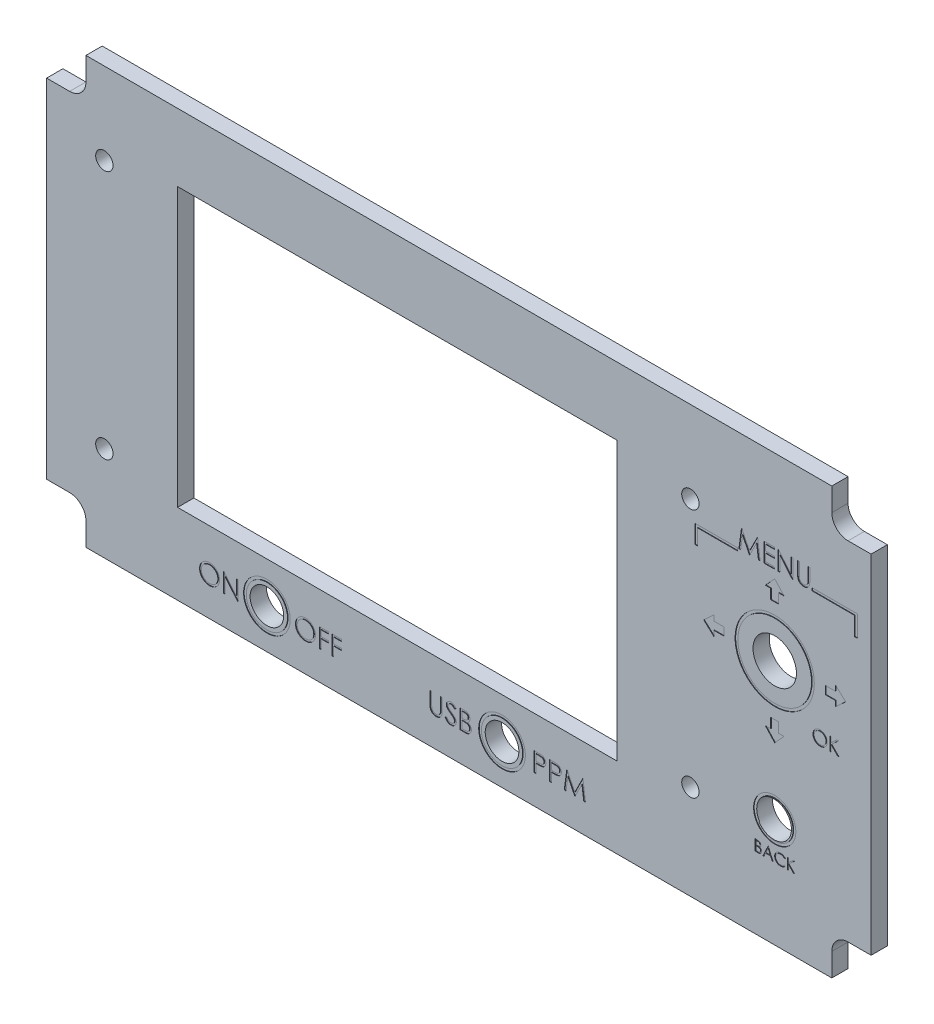
from build123d import *

# Parameters (mm, degrees)
ESQUISSE1_R             = 3.1
ESQUISSE1_R_2           = 1.6
ESQUISSE1_R_3           = 4
ESQUISSE1_R_4           = 3.25
ESQUISSE1_W             = 81
ESQUISSE1_H             = 51.2
BOSS_EXTRU_1_DEPTH      = 3
GRAVURE_R               = 7.295589695
GRAVURE_R_2             = 6.795589695
GRAVURE_R_3             = 3.892751957
GRAVURE_R_4             = 3.392751957
GRAVURE_R_5             = 4.3
GRAVURE_R_6             = 3.8
ENL_V_MAT_EXTRU_1_DEPTH = 0.1


with BuildPart() as part:
    # Esquisse1 → Boss.-Extru.1 (new body)
    with BuildSketch(Plane.XY.offset(3.8)):
        with BuildLine():
            Line((-115.589634865, 32.662850462), (-119.832275552, 32.662850462))
            Line((-119.832275552, 32.662850462), (-119.832275552, -31.368742114))
            Line((-119.832275552, -31.368742114), (-115.589634865, -31.368742114))
            ThreePointArc((-115.589634865, -31.368742114), (-113.468314521, -32.24742177), (-112.589634865, -34.368742114))
            Line((-112.589634865, -34.368742114), (-112.589634865, -38.611382801))
            Line((-112.589634865, -38.611382801), (24.864852981, -38.611382801))
            Line((24.864852981, -38.611382801), (24.864852981, -34.368742114))
            ThreePointArc((24.864852981, -34.368742114), (25.743532637, -32.24742177), (27.864852981, -31.368742114))
            Line((27.864852981, -31.368742114), (32.107493668, -31.368742114))
            Line((32.107493668, -31.368742114), (32.107493668, 32.662850462))
            Line((32.107493668, 32.662850462), (27.864852981, 32.662850462))
            ThreePointArc((27.864852981, 32.662850462), (25.743532637, 33.541530119), (24.864852981, 35.662850462))
            Line((24.864852981, 35.662850462), (24.864852981, 39.905491149))
            Line((24.864852981, 39.905491149), (-112.589634865, 39.905491149))
            Line((-112.589634865, 39.905491149), (-112.589634865, 35.662850462))
            ThreePointArc((-112.589634865, 35.662850462), (-113.468314521, 33.541530119), (-115.589634865, 32.662850462))
        make_face()
        with Locations((-35.905557573, -31.316718293)):
            Circle(ESQUISSE1_R, mode=Mode.SUBTRACT)
        with Locations((-1.194417438, 24.821428571)):
            Circle(ESQUISSE1_R_2, mode=Mode.SUBTRACT)
        with Locations((-109.194417438, 24.821428571)):
            Circle(ESQUISSE1_R_2, mode=Mode.SUBTRACT)
        with Locations((-109.194417438, -21.178571429)):
            Circle(ESQUISSE1_R_2, mode=Mode.SUBTRACT)
        with Locations((-79.237508709, -31.316718293)):
            Circle(ESQUISSE1_R, mode=Mode.SUBTRACT)
        with Locations((-1.194417438, -21.178571429)):
            Circle(ESQUISSE1_R_2, mode=Mode.SUBTRACT)
        with Locations((14.345224597, 6.749852674)):
            Circle(ESQUISSE1_R_3, mode=Mode.SUBTRACT)
        with Locations((14.176552179, -18.611382801)):
            Circle(ESQUISSE1_R_4, mode=Mode.SUBTRACT)
        with Locations((-55.194417438, 1.821428571)):
            Rectangle(ESQUISSE1_W, ESQUISSE1_H, mode=Mode.SUBTRACT)
    extrude(amount=BOSS_EXTRU_1_DEPTH)

    # Gravure → Enlèv. mat.-Extru.1 (cut)
    # profile 1 of 31: a face of its own
    with BuildSketch(Plane.XY.offset(6.8)):
        with Locations((14.345224597, 6.749852674)):
            Circle(GRAVURE_R)
        with Locations((14.345224597, 6.749852674)):
            Circle(GRAVURE_R_2, mode=Mode.SUBTRACT)
    # profile 2 of 31: a face of its own
    with BuildSketch(Plane.XY.offset(6.8)):
        with Locations((14.345224597, -18.611382801)):
            Circle(GRAVURE_R_3)
        with Locations((14.345224597, -18.611382801)):
            Circle(GRAVURE_R_4, mode=Mode.SUBTRACT)
    # profile 3 of 31: a face of its own
    with BuildSketch(Plane.XY.offset(6.8)):
        with Locations((-79.237508709, -31.316718293)):
            Circle(GRAVURE_R_5)
        with Locations((-79.237508709, -31.316718293)):
            Circle(GRAVURE_R_6, mode=Mode.SUBTRACT)
    # profile 4 of 31: a face of its own
    with BuildSketch(Plane.XY.offset(6.8)):
        with Locations((-35.905557573, -31.316718293)):
            Circle(GRAVURE_R_5)
        with Locations((-35.905557573, -31.316718293)):
            Circle(GRAVURE_R_6, mode=Mode.SUBTRACT)
    # profile 5 of 31: a face of its own
    with BuildSketch(Plane.XY.offset(6.8)):
        Polygon((-0.376307372, 21.359912167), (-0.376307372, 17.961619409), (0.123692628, 17.961619409), (0.123692628, 20.859912167), (7.485840066, 20.859912167), (7.485840066, 21.359912167), align=None)
    # profile 6 of 31: a face of its own
    with BuildSketch(Plane.XY.offset(6.8)):
        Polygon((13.608406502, 16.139308456), (15.082042692, 16.139308456), (15.082042692, 17.961619409), (16.066756566, 17.961619409), (14.345224597, 19.835578794), (12.623692628, 17.961619409), (13.608406502, 17.961619409), align=None)
    # profile 7 of 31: a face of its own
    with BuildSketch(Plane.XY.offset(6.8)):
        Polygon((25.556991332, 6.013034579), (23.734680379, 6.013034579), (23.734680379, 7.48667077), (25.556991332, 7.48667077), (25.556991332, 8.471384644), (27.430950717, 6.749852674), (25.556991332, 5.028320705), align=None)
    # profile 8 of 31: a face of its own
    with BuildSketch(Plane.XY.offset(6.8)):
        Polygon((13.608406502, -4.46191406), (13.608406502, -2.639603107), (15.082042692, -2.639603107), (15.082042692, -4.46191406), (16.066756566, -4.46191406), (14.345224597, -6.335873445), (12.623692628, -4.46191406), align=None)
    # profile 9 of 31: a face of its own
    with BuildSketch(Plane.XY.offset(6.8)):
        Polygon((3.133457862, 7.48667077), (4.955768816, 7.48667077), (4.955768816, 6.013034579), (3.133457862, 6.013034579), (3.133457862, 5.028320705), (1.259498478, 6.749852674), (3.133457862, 8.471384644), align=None)
    # profile 10 of 31: a face of its own
    with BuildSketch(Plane.XY.offset(6.8)):
        Polygon((21.204609129, 21.359912167), (29.066756566, 21.359912167), (29.066756566, 17.961619409), (29.566756566, 17.961619409), (29.566756566, 21.859912167), (21.204609129, 21.859912167), align=None)
    # profile 11 of 31: a face of its own
    with BuildSketch(Plane.XY.offset(6.8)):
        Polygon((7.755070835, 21.359912167), (8.217110098, 24.859912167), (8.261981893, 24.859912167), (9.706993912, 21.988117295), (11.148500322, 24.859912167), (11.194073239, 24.859912167), (11.658916989, 21.359912167), (11.343412181, 21.359912167), (11.008275963, 23.878341654), (9.744854489, 21.359912167), (9.674041187, 21.359912167), (8.405711861, 23.883950628), (8.071276764, 21.359912167), align=None)
    # profile 12 of 31: a face of its own
    with BuildSketch(Plane.XY.offset(6.8)):
        Polygon((12.376865707, 24.859912167), (14.351224681, 24.859912167), (14.351224681, 24.500937808), (12.690968271, 24.500937808), (12.690968271, 23.424014731), (14.351224681, 23.424014731), (14.351224681, 23.065040372), (12.690968271, 23.065040372), (12.690968271, 21.718886526), (14.351224681, 21.718886526), (14.351224681, 21.359912167), (12.376865707, 21.359912167), align=None)
    # profile 13 of 31: a face of its own
    with BuildSketch(Plane.XY.offset(6.8)):
        Polygon((14.979429809, 21.359912167), (14.979429809, 24.859912167), (15.045335258, 24.859912167), (17.357634937, 22.105204634), (17.357634937, 24.859912167), (17.671737502, 24.859912167), (17.671737502, 21.359912167), (17.600223079, 21.359912167), (15.293532373, 24.108309602), (15.293532373, 21.359912167), align=None)
    # profile 14 of 31: a face of its own
    with BuildSketch(Plane.XY.offset(6.8)):
        with BuildLine():
            Line((18.569173399, 24.859912167), (18.883275963, 24.859912167))
            Line((18.883275963, 24.859912167), (18.883275963, 22.762856878))
            add(Edge.make_bspline(
                [(18.883275963, 22.762856878), (18.883229219, 22.733176142), (18.883140514, 22.676851831), (18.883733028, 22.596683531), (18.885392397, 22.525411072), (18.886438556, 22.462759724), (18.88876589, 22.409016977), (18.890663937, 22.363891666), (18.893104493, 22.327597464), (18.896037611, 22.306416538), (18.897298399, 22.297312006)],
                knots=[0, 0, 0, 0, 1.528628734, 2.90083645, 4.128790002, 5.200304208, 6.127813768, 6.898992206, 7.526736466, 8, 8, 8, 8], degree=3))
            add(Edge.make_bspline(
                [(18.897298399, 22.297312006), (18.902475858, 22.264465243), (18.912539044, 22.200622514), (18.938185422, 22.109714232), (18.974002923, 22.027782774), (19.016445966, 21.952271483), (19.072378577, 21.885282123), (19.139382112, 21.82357047), (19.220559881, 21.769598665), (19.310820487, 21.720247853), (19.408105724, 21.680582771), (19.50751699, 21.650589407), (19.60755997, 21.632310507), (19.674536135, 21.630193968), (19.707795194, 21.629142936)],
                knots=[0, 0, 0, 0, 1.035780045, 2.013197591, 2.933192213, 3.817615948, 4.702609284, 5.640816605, 6.646850145, 7.73207398, 8.84249596, 9.914020372, 10.964143139, 12, 12, 12, 12], degree=3))
            add(Edge.make_bspline(
                [(19.707795194, 21.629142936), (19.736348934, 21.630216786), (19.793291496, 21.632358284), (19.877897927, 21.645619715), (19.960298036, 21.669520281), (20.040898715, 21.700360039), (20.1164497, 21.741107631), (20.186993142, 21.78817847), (20.249957076, 21.843389346), (20.307415074, 21.904489691), (20.35745001, 21.973429491), (20.400821151, 22.048707629), (20.436347081, 22.131456975), (20.453890606, 22.189611398), (20.462903367, 22.219487487)],
                knots=[0, 0, 0, 0, 0.994687771, 1.983630487, 2.973142513, 3.978332533, 4.983357753, 5.956394766, 6.925816176, 7.893390482, 8.871859704, 9.88551698, 10.913711441, 12, 12, 12, 12], degree=3))
            add(Edge.make_bspline(
                [(20.462903367, 22.219487487), (20.465903492, 22.231836061), (20.47258898, 22.259353661), (20.478836025, 22.305874952), (20.485342551, 22.360764316), (20.489857121, 22.424416129), (20.494258341, 22.496617101), (20.496891414, 22.577743359), (20.498108447, 22.66750032), (20.498471127, 22.730137481), (20.498660579, 22.762856878)],
                knots=[0, 0, 0, 0, 0.558680831, 1.244966039, 2.062412453, 2.990489873, 4.051219941, 5.244515665, 6.560634259, 8, 8, 8, 8], degree=3))
            Line((20.498660579, 22.762856878), (20.498660579, 24.859912167))
            Line((20.498660579, 24.859912167), (20.812763143, 24.859912167))
            Line((20.812763143, 24.859912167), (20.812763143, 22.746029955))
            add(Edge.make_bspline(
                [(20.812763143, 22.746029955), (20.812509022, 22.707931576), (20.812013091, 22.633580273), (20.807712514, 22.524628914), (20.800855515, 22.421275933), (20.791167427, 22.323507436), (20.778330423, 22.231673277), (20.764055203, 22.144968509), (20.74587567, 22.064015516), (20.724642269, 21.988183099), (20.700368721, 21.915997585), (20.668927572, 21.847488971), (20.633503072, 21.780574571), (20.591488419, 21.716266462), (20.544277037, 21.654279909), (20.490825356, 21.594990834), (20.432901195, 21.537451788), (20.369541636, 21.483138721), (20.30179111, 21.433330045), (20.229851153, 21.389532273), (20.154274383, 21.352508656), (20.075257257, 21.322032732), (19.992766054, 21.299118132), (19.906798694, 21.282042977), (19.817159501, 21.272340679), (19.756194845, 21.270898749), (19.725323239, 21.270168577)],
                knots=[0, 0, 0, 0, 1.316592851, 2.569410997, 3.76748051, 4.895814652, 5.963796859, 6.97159953, 7.931736103, 8.829262218, 9.692595152, 10.560224239, 11.431080259, 12.30701507, 13.211635791, 14.121146779, 15.063487852, 16.031507147, 17.00238618, 17.966455255, 18.938106653, 19.907068911, 20.888905087, 21.893141452, 22.933117798, 24, 24, 24, 24], degree=3))
            add(Edge.make_bspline(
                [(19.725323239, 21.270168577), (19.691654136, 21.270953342), (19.625595477, 21.272493049), (19.52825741, 21.281315799), (19.434943214, 21.297934193), (19.344667337, 21.319094137), (19.25865884, 21.348277874), (19.175765395, 21.382375999), (19.097406714, 21.424253259), (19.022311585, 21.470846652), (18.952486829, 21.52327129), (18.888389426, 21.580411464), (18.829913556, 21.641351842), (18.778044859, 21.706752208), (18.731923975, 21.776103915), (18.692193761, 21.849603154), (18.658080517, 21.927221471), (18.64047395, 21.981174671), (18.631573239, 22.008449827)],
                knots=[0, 0, 0, 0, 1.13879206, 2.234305948, 3.301075583, 4.341971843, 5.366689343, 6.369221514, 7.369726634, 8.367512178, 9.355451585, 10.318319045, 11.268648973, 12.207971039, 13.137398894, 14.081662264, 15.030215811, 16, 16, 16, 16], degree=3))
            add(Edge.make_bspline(
                [(18.631573239, 22.008449827), (18.626396081, 22.027082401), (18.615166709, 22.06749687), (18.603141412, 22.134383359), (18.59303233, 22.211398276), (18.583526772, 22.298546895), (18.577917814, 22.395896761), (18.573000375, 22.503405677), (18.569138756, 22.621203639), (18.569161529, 22.703258155), (18.569173399, 22.746029955)],
                knots=[0, 0, 0, 0, 0.625038921, 1.35572334, 2.194682327, 3.136881307, 4.189498639, 5.346923369, 6.617055217, 8, 8, 8, 8], degree=3))
            Line((18.569173399, 22.746029955), (18.569173399, 24.859912167))
        make_face()
    # profile 15 of 31: a face of its own
    with BuildSketch(Plane.XY.offset(6.8)):
        with BuildLine():
            Line((10.753500545, -23.42033201), (11.143724904, -23.42033201))
            add(Edge.make_bspline(
                [(11.143724904, -23.42033201), (11.162826891, -23.420432439), (11.199851297, -23.420627095), (11.253690978, -23.423646027), (11.30411887, -23.42776241), (11.351149597, -23.434293891), (11.394761427, -23.442174907), (11.435085791, -23.451718802), (11.471994461, -23.463162581), (11.516058882, -23.481360456), (11.566299259, -23.508402267), (11.620698341, -23.548361447), (11.667215049, -23.59723714), (11.707321516, -23.652370086), (11.73920787, -23.713019098), (11.76227604, -23.777738635), (11.77688054, -23.845693916), (11.778382503, -23.89234716), (11.77914157, -23.915924959)],
                knots=[0, 0, 0, 0, 1.001505555, 1.941167018, 2.826882275, 3.653841531, 4.429895133, 5.150066043, 5.825578002, 6.45369114, 7.647487171, 8.808567382, 9.977351308, 11.170798116, 12.373658725, 13.556498008, 14.765093433, 16, 16, 16, 16], degree=3))
            add(Edge.make_bspline(
                [(11.77914157, -23.915924959), (11.778516874, -23.938012134), (11.777289287, -23.981415515), (11.765550567, -24.044897863), (11.747173043, -24.105327131), (11.721627186, -24.16248278), (11.688426045, -24.215073416), (11.649078435, -24.263523282), (11.601605976, -24.305781029), (11.56603841, -24.329405545), (11.547971699, -24.341405728)],
                knots=[0, 0, 0, 0, 1.044552857, 2.05264487, 3.044412934, 4.028983338, 5.005914585, 5.980388656, 6.974128949, 8, 8, 8, 8], degree=3))
            add(Edge.make_bspline(
                [(11.547971699, -24.341405728), (11.570691943, -24.350128585), (11.614161399, -24.36681757), (11.673981977, -24.396323549), (11.725521889, -24.428416184), (11.769177401, -24.463462955), (11.806513203, -24.501239419), (11.839114884, -24.542299484), (11.866932812, -24.587178774), (11.890768769, -24.635409366), (11.909368058, -24.686498776), (11.923297146, -24.739967791), (11.931278546, -24.79562468), (11.932414341, -24.83350204), (11.932987724, -24.852623677)],
                knots=[0, 0, 0, 0, 1.27268992, 2.434971085, 3.483601985, 4.442670788, 5.356604649, 6.2567628, 7.179492994, 8.113709626, 9.066344395, 10.018646069, 10.999752585, 12, 12, 12, 12], degree=3))
            add(Edge.make_bspline(
                [(11.932987724, -24.852623677), (11.932429526, -24.872147604), (11.931331257, -24.910561477), (11.923228416, -24.966992982), (11.909508926, -25.020921523), (11.890611128, -25.072695913), (11.865946948, -25.12221599), (11.835930969, -25.169537855), (11.800141504, -25.214186044), (11.760105579, -25.256656686), (11.714812924, -25.294843993), (11.665946779, -25.328852968), (11.612891739, -25.356822147), (11.556519171, -25.380317016), (11.496196704, -25.398263987), (11.432195214, -25.410819743), (11.364569899, -25.419279764), (11.318164327, -25.41997531), (11.294365929, -25.42033201)],
                knots=[0, 0, 0, 0, 0.978564426, 1.925352924, 2.850884081, 3.763762016, 4.682927383, 5.618979971, 6.567305752, 7.547517671, 8.540179244, 9.531824382, 10.526200242, 11.540722885, 12.589160233, 13.674978461, 14.80764778, 16, 16, 16, 16], degree=3))
            Line((11.294365929, -25.42033201), (10.753500545, -25.42033201))
            Line((10.753500545, -25.42033201), (10.753500545, -23.42033201))
        make_face()
        with BuildLine():
            Line((10.932987724, -23.625460215), (10.932987724, -24.266485856))
            Line((10.932987724, -24.266485856), (11.053580673, -24.266485856))
            add(Edge.make_bspline(
                [(11.053580673, -24.266485856), (11.071208556, -24.266257329), (11.105269218, -24.265815767), (11.154594874, -24.2645509), (11.200380598, -24.261009161), (11.24254736, -24.25746844), (11.281028757, -24.251711533), (11.315739535, -24.244858891), (11.347224447, -24.237611517), (11.383532759, -24.225286096), (11.424717301, -24.207070281), (11.468621932, -24.178800661), (11.507327343, -24.145129602), (11.54001145, -24.106277624), (11.566760862, -24.063496946), (11.585340128, -24.017470157), (11.597938576, -23.969344368), (11.599076594, -23.936305366), (11.599654391, -23.919530728)],
                knots=[0, 0, 0, 0, 1.156816544, 2.235205308, 3.236616184, 4.169592532, 5.011045266, 5.787822928, 6.49130361, 7.128639758, 8.301311294, 9.436451833, 10.541879658, 11.654887649, 12.756523258, 13.837046038, 14.901820046, 16, 16, 16, 16], degree=3))
            add(Edge.make_bspline(
                [(11.599654391, -23.919530728), (11.599353717, -23.908430287), (11.598763911, -23.88665556), (11.593933452, -23.854913072), (11.58572341, -23.825059499), (11.575178099, -23.796685722), (11.560441706, -23.770678951), (11.543091155, -23.746139982), (11.522127904, -23.723904485), (11.498266582, -23.703121915), (11.470833083, -23.68469647), (11.439843774, -23.668558891), (11.404879387, -23.655564162), (11.366529184, -23.644183503), (11.324202848, -23.636190193), (11.278388818, -23.629531114), (11.228711835, -23.626140976), (11.194343205, -23.625692197), (11.176577468, -23.625460215)],
                knots=[0, 0, 0, 0, 0.91205012, 1.789085906, 2.630437955, 3.453916878, 4.269457761, 5.079663411, 5.91843418, 6.774407191, 7.675494373, 8.627863946, 9.638891023, 10.736472738, 11.911756761, 13.175263542, 14.539845004, 16, 16, 16, 16], degree=3))
            Line((11.176577468, -23.625460215), (10.932987724, -23.625460215))
        make_face(mode=Mode.SUBTRACT)
        with BuildLine():
            Line((10.932987724, -24.471614061), (10.932987724, -25.215203805))
            Line((10.932987724, -25.215203805), (11.188596699, -25.215203805))
            add(Edge.make_bspline(
                [(11.188596699, -25.215203805), (11.206893228, -25.214984521), (11.242157375, -25.214561879), (11.293072364, -25.213182134), (11.340262709, -25.210043691), (11.383513072, -25.205103205), (11.423290474, -25.199744091), (11.459117733, -25.192537645), (11.491285272, -25.184281096), (11.528584876, -25.171518712), (11.570586881, -25.151692157), (11.615850228, -25.121798314), (11.656093781, -25.086184995), (11.690268215, -25.04496733), (11.718275637, -25.000149429), (11.738650182, -24.9526378), (11.751216386, -24.903217499), (11.752737626, -24.869522234), (11.753500545, -24.852623677)],
                knots=[0, 0, 0, 0, 1.160039823, 2.235823828, 3.228722157, 4.157150951, 4.99529583, 5.772374946, 6.472645482, 7.099169577, 8.269452708, 9.405989375, 10.527446681, 11.663510218, 12.788923519, 13.866172445, 14.929861265, 16, 16, 16, 16], degree=3))
            add(Edge.make_bspline(
                [(11.753500545, -24.852623677), (11.753342771, -24.842056054), (11.753029768, -24.821091264), (11.748309417, -24.790282225), (11.741444348, -24.760438868), (11.732569243, -24.73148016), (11.719643833, -24.703929659), (11.704554379, -24.677242482), (11.686862149, -24.651383351), (11.659294055, -24.618690635), (11.619195778, -24.58102377), (11.562220478, -24.544145197), (11.497436307, -24.514403593), (11.450449168, -24.501775321), (11.426176827, -24.495251882)],
                knots=[0, 0, 0, 0, 0.723448775, 1.435228256, 2.130040452, 2.821711965, 3.505591119, 4.210454504, 4.921174351, 5.648778258, 7.137944449, 8.670945889, 10.280296675, 12, 12, 12, 12], degree=3))
            add(Edge.make_bspline(
                [(11.426176827, -24.495251882), (11.416445915, -24.493277548), (11.395347291, -24.488996786), (11.360942959, -24.484478098), (11.32166532, -24.480452349), (11.277423676, -24.477474545), (11.228162052, -24.47439652), (11.173775241, -24.47319948), (11.114485347, -24.471771331), (11.073346849, -24.471667826), (11.051978109, -24.471614061)],
                knots=[0, 0, 0, 0, 0.634451884, 1.375622551, 2.216452059, 3.157844607, 4.20941857, 5.370758133, 6.634282058, 8, 8, 8, 8], degree=3))
            Line((11.051978109, -24.471614061), (10.932987724, -24.471614061))
        make_face(mode=Mode.SUBTRACT)
    # profile 16 of 31: a face of its own
    with BuildSketch(Plane.XY.offset(6.8)):
        Polygon((13.163756955, -23.42033201), (14.086833878, -25.42033201), (13.891721699, -25.42033201), (13.596048622, -24.779306369), (12.689397981, -24.779306369), (12.385311442, -25.42033201), (12.189397981, -25.42033201), (13.138115929, -23.42033201), align=None)
        Polygon((13.148933237, -23.810155728), (12.78675375, -24.574178164), (13.50149734, -24.574178164), align=None, mode=Mode.SUBTRACT)
    # profile 17 of 31: a face of its own
    with BuildSketch(Plane.XY.offset(6.8)):
        with BuildLine():
            Line((16.291962083, -23.78731919), (16.134910801, -23.907511497))
            add(Edge.make_bspline(
                [(16.134910801, -23.907511497), (16.123707436, -23.894159515), (16.101451752, -23.867635563), (16.065646494, -23.830390109), (16.028331269, -23.795495674), (15.989520343, -23.762786028), (15.948515132, -23.733405019), (15.906308961, -23.705821532), (15.862195792, -23.68109711), (15.801194801, -23.651118261), (15.721396031, -23.619834744), (15.620941837, -23.593604326), (15.516078352, -23.576906511), (15.444536867, -23.57509803), (15.408147981, -23.574178164)],
                knots=[0, 0, 0, 0, 0.757959112, 1.505699292, 2.245454638, 2.979532153, 3.711538275, 4.438200793, 5.171680507, 5.909471876, 7.393775596, 8.890124382, 10.418191784, 12, 12, 12, 12], degree=3))
            add(Edge.make_bspline(
                [(15.408147981, -23.574178164), (15.388100381, -23.574409), (15.348191242, -23.574868529), (15.288963543, -23.580930886), (15.2308418, -23.589451578), (15.173863819, -23.602094619), (15.118102128, -23.618078973), (15.063192184, -23.63717921), (15.009928985, -23.660810547), (14.957575706, -23.686929552), (14.907416156, -23.716430949), (14.859956129, -23.748610008), (14.815368719, -23.783106634), (14.773618655, -23.820050124), (14.734663256, -23.859274101), (14.698784792, -23.901196582), (14.666107415, -23.945683538), (14.635983401, -23.992148342), (14.609004696, -24.040455652), (14.586416194, -24.090784264), (14.566413267, -24.142272323), (14.550585128, -24.195501557), (14.538056833, -24.250097423), (14.529412454, -24.306206445), (14.523419041, -24.363711405), (14.522961798, -24.402688155), (14.522731314, -24.422335215)],
                knots=[0, 0, 0, 0, 1.054917814, 2.100044995, 3.131103042, 4.146048494, 5.169673617, 6.183595914, 7.203665975, 8.234915748, 9.262203917, 10.264457458, 11.251630812, 12.227803204, 13.197192746, 14.159520551, 15.12972552, 16.100847026, 17.073214652, 18.039054194, 19.002613845, 19.979014051, 20.95965708, 21.949030935, 22.966165397, 24, 24, 24, 24], degree=3))
            add(Edge.make_bspline(
                [(14.522731314, -24.422335215), (14.523452353, -24.45189597), (14.524868019, -24.509934589), (14.537467067, -24.594946367), (14.556612833, -24.676386752), (14.585307449, -24.753746662), (14.620689763, -24.827980009), (14.665398684, -24.897830783), (14.717179563, -24.964354534), (14.776764945, -25.025979075), (14.842139697, -25.082272633), (14.912281361, -25.131844394), (14.98701524, -25.173167184), (15.065516171, -25.207553439), (15.148388236, -25.233985855), (15.235482409, -25.252593925), (15.326609263, -25.264732314), (15.388877492, -25.265894421), (15.420567852, -25.266485856)],
                knots=[0, 0, 0, 0, 1.029171465, 2.020641659, 2.987623507, 3.938342917, 4.889210282, 5.84687017, 6.821220943, 7.821438502, 8.827599549, 9.822697543, 10.807740252, 11.797342354, 12.80366471, 13.83203677, 14.896651826, 16, 16, 16, 16], degree=3))
            add(Edge.make_bspline(
                [(15.420567852, -25.266485856), (15.455483675, -25.265520839), (15.524206366, -25.263621455), (15.624988095, -25.247530456), (15.721465675, -25.221440217), (15.813644296, -25.184927118), (15.901264094, -25.13746124), (15.984462186, -25.079919595), (16.063308797, -25.011754834), (16.110720959, -24.959707332), (16.134910801, -24.933152523)],
                knots=[0, 0, 0, 0, 1.028121516, 2.023589091, 2.998037872, 3.967518031, 4.937445131, 5.927275754, 6.942489185, 8, 8, 8, 8], degree=3))
            Line((16.134910801, -24.933152523), (16.291962083, -25.052142908))
            add(Edge.make_bspline(
                [(16.291962083, -25.052142908), (16.279323163, -25.068450594), (16.254105863, -25.100987855), (16.213272711, -25.146857404), (16.170257112, -25.190002567), (16.124739563, -25.230075493), (16.077243683, -25.267878045), (16.026916647, -25.302336234), (15.974420057, -25.333931025), (15.919931783, -25.362860696), (15.863509719, -25.388527695), (15.80522147, -25.410501276), (15.745318284, -25.429429785), (15.683797422, -25.44500232), (15.620531276, -25.457157225), (15.555748148, -25.465282753), (15.489308219, -25.470849562), (15.44448455, -25.471356942), (15.421769776, -25.471614061)],
                knots=[0, 0, 0, 0, 0.986787822, 1.968848986, 2.935600012, 3.899624008, 4.868462664, 5.837806735, 6.815139263, 7.798259679, 8.787526145, 9.778297419, 10.776456485, 11.791383307, 12.812564526, 13.85620153, 14.913611965, 16, 16, 16, 16], degree=3))
            add(Edge.make_bspline(
                [(15.421769776, -25.471614061), (15.400259109, -25.471464351), (15.357724429, -25.471168318), (15.294925142, -25.466372794), (15.233788239, -25.459830087), (15.174488452, -25.449978584), (15.116702181, -25.438353247), (15.060953276, -25.422769671), (15.006693155, -25.405313005), (14.954139818, -25.38479587), (14.903248561, -25.361643765), (14.854183526, -25.33547716), (14.806967279, -25.306516095), (14.76113561, -25.275398946), (14.717365562, -25.241126202), (14.675277833, -25.204173839), (14.634636418, -25.164666405), (14.609492027, -25.136177917), (14.596849904, -25.121854446)],
                knots=[0, 0, 0, 0, 1.114604814, 2.203992996, 3.262667896, 4.300477797, 5.318619304, 6.316056647, 7.298880507, 8.271930387, 9.238335007, 10.195173496, 11.151986948, 12.108099108, 13.064862484, 14.031167946, 15.010108607, 16, 16, 16, 16], degree=3))
            add(Edge.make_bspline(
                [(14.596849904, -25.121854446), (14.576600965, -25.096973767), (14.536347549, -25.047512789), (14.484847159, -24.967349371), (14.440762841, -24.883653252), (14.405119458, -24.795984721), (14.377255039, -24.7045405), (14.357951499, -24.609274492), (14.345407725, -24.510275668), (14.343973274, -24.44294036), (14.343244134, -24.40871342)],
                knots=[0, 0, 0, 0, 0.994628077, 1.977248131, 2.950237994, 3.925870899, 4.908910175, 5.911660606, 6.938484602, 8, 8, 8, 8], degree=3))
            add(Edge.make_bspline(
                [(14.343244134, -24.40871342), (14.344132817, -24.372738876), (14.345881243, -24.301961204), (14.360735983, -24.198090374), (14.384632438, -24.098575289), (14.418573517, -24.003601721), (14.461605147, -23.912670132), (14.514763212, -23.826475158), (14.57743015, -23.744465558), (14.649114475, -23.6678857), (14.72772438, -23.597863213), (14.81190656, -23.536259668), (14.901496244, -23.484992516), (14.995506445, -23.442137566), (15.09464112, -23.409197873), (15.198688759, -23.386138909), (15.307453854, -23.371786271), (15.381660954, -23.369971866), (15.419365929, -23.369049959)],
                knots=[0, 0, 0, 0, 1.032925535, 2.032216505, 3.007276963, 3.968222605, 4.92396291, 5.891752235, 6.871517503, 7.883894988, 8.900124299, 9.891468569, 10.874487609, 11.85992873, 12.854644235, 13.869047385, 14.917252991, 16, 16, 16, 16], degree=3))
            add(Edge.make_bspline(
                [(15.419365929, -23.369049959), (15.442345628, -23.369325466), (15.487831626, -23.369870806), (15.555118856, -23.375188601), (15.620628757, -23.384053519), (15.684406461, -23.396119845), (15.746762242, -23.411095457), (15.807219522, -23.430604199), (15.866133058, -23.452910788), (15.923131291, -23.47860134), (15.977940748, -23.507439478), (16.030544359, -23.539105549), (16.080524278, -23.573560295), (16.128232191, -23.610510681), (16.172870026, -23.650738429), (16.215705157, -23.693137055), (16.255282916, -23.738927812), (16.279713313, -23.771159203), (16.291962083, -23.78731919)],
                knots=[0, 0, 0, 0, 1.096760587, 2.17092713, 3.219439832, 4.250915756, 5.268269357, 6.278326846, 7.281116186, 8.274029601, 9.260640565, 10.235837813, 11.203064059, 12.156899882, 13.114053108, 14.069676657, 15.032185724, 16, 16, 16, 16], degree=3))
        make_face()
    # profile 18 of 31: a face of its own
    with BuildSketch(Plane.XY.offset(6.8)):
        Polygon((16.702218493, -23.42033201), (16.881705673, -23.42033201), (16.881705673, -24.1819506), (17.715439647, -23.42033201), (17.971449263, -23.42033201), (16.988676827, -24.317767908), (18.04837234, -25.42033201), (17.809189647, -25.42033201), (16.881705673, -24.455187779), (16.881705673, -25.42033201), (16.702218493, -25.42033201), align=None)
    # profile 19 of 31: a face of its own
    with BuildSketch(Plane.XY.offset(6.8)):
        with BuildLine():
            add(Edge.make_bspline(
                [(22.694993744, -0.075500543), (22.741285248, -0.076673028), (22.832205582, -0.078975886), (22.965830509, -0.096603817), (23.093398434, -0.127100524), (23.215948533, -0.16771694), (23.332014945, -0.221898644), (23.442471297, -0.287388036), (23.547054778, -0.364871221), (23.644355765, -0.45374924), (23.733396444, -0.550451707), (23.811843505, -0.653650214), (23.877588001, -0.762720787), (23.931577849, -0.877335666), (23.973933999, -0.997235644), (24.003161887, -1.123059931), (24.021831994, -1.253993281), (24.024014692, -1.343298185), (24.025121949, -1.388601505)],
                knots=[0, 0, 0, 0, 1.065120563, 2.091984664, 3.0946048, 4.079830382, 5.057816894, 6.036188127, 7.030412546, 8.04752943, 9.064399622, 10.05169764, 11.02544977, 11.989514704, 12.962713494, 13.945757189, 14.957906945, 16, 16, 16, 16], degree=3))
            add(Edge.make_bspline(
                [(24.025121949, -1.388601505), (24.024014855, -1.433571109), (24.021832643, -1.52221141), (24.003140659, -1.65231387), (23.973825659, -1.777378653), (23.931971183, -1.897196976), (23.878238698, -2.011895236), (23.812056433, -2.121171632), (23.734098426, -2.225061988), (23.645379246, -2.322428177), (23.548664216, -2.411712085), (23.444928311, -2.489511282), (23.336504511, -2.556457085), (23.221997577, -2.609873995), (23.102926122, -2.652568224), (22.978224463, -2.681677245), (22.848476924, -2.700453705), (22.759997636, -2.702609788), (22.715025795, -2.703705671)],
                knots=[0, 0, 0, 0, 1.043624062, 2.057103931, 3.04512605, 4.022047818, 4.998200453, 5.980619268, 6.982898556, 8.009068085, 9.034988726, 10.034168286, 11.015286542, 11.987931943, 12.962482838, 13.94673481, 14.956375938, 16, 16, 16, 16], degree=3))
            add(Edge.make_bspline(
                [(22.715025795, -2.703705671), (22.66972271, -2.702598966), (22.58041827, -2.700417357), (22.449320388, -2.681716353), (22.323407714, -2.652472565), (22.20304032, -2.61068011), (22.088151085, -2.556667803), (21.978515311, -2.490807532), (21.874573063, -2.412659574), (21.777186102, -2.323969163), (21.688079531, -2.227418055), (21.610394263, -2.123965015), (21.544519182, -2.015639689), (21.49068823, -1.902141458), (21.448070759, -1.784018999), (21.418995889, -1.660484372), (21.400184495, -1.532241868), (21.398016747, -1.444925512), (21.396916821, -1.400620735)],
                knots=[0, 0, 0, 0, 1.053102029, 2.075944431, 3.073151272, 4.055350789, 5.033113405, 6.020478099, 7.024410459, 8.052272461, 9.079885166, 10.07527673, 11.055994387, 12.023226415, 12.992069828, 13.970394897, 14.97016774, 16, 16, 16, 16], degree=3))
            add(Edge.make_bspline(
                [(21.396916821, -1.400620735), (21.397298703, -1.370883115), (21.398057651, -1.311783026), (21.407194574, -1.224021169), (21.420452932, -1.137670699), (21.439454298, -1.052977165), (21.464305489, -0.97014789), (21.493628366, -0.888611631), (21.529442541, -0.809194686), (21.569928718, -0.731520834), (21.615115724, -0.656800902), (21.665026973, -0.586172628), (21.717909379, -0.519043345), (21.775883232, -0.457152627), (21.837037836, -0.398700016), (21.902365249, -0.344583789), (21.971466852, -0.294315967), (22.04463998, -0.249015724), (22.120081605, -0.208044913), (22.197850732, -0.172886448), (22.27689114, -0.14271069), (22.357573032, -0.118252958), (22.439682155, -0.098944361), (22.523397715, -0.085796251), (22.608653019, -0.076636024), (22.666089676, -0.075880665), (22.694993744, -0.075500543)],
                knots=[0, 0, 0, 0, 1.037015668, 2.060948919, 3.074880161, 4.083647147, 5.086022904, 6.090072063, 7.104153813, 8.122640571, 9.144368836, 10.147691507, 11.138137339, 12.123020368, 13.103399296, 14.087645067, 15.080126199, 16.082011238, 17.087798457, 18.072939717, 19.057185487, 20.037253025, 21.01195951, 21.997135196, 22.992090687, 24, 24, 24, 24], degree=3))
        make_face()
        with BuildLine():
            add(Edge.make_bspline(
                [(22.706011372, -0.3319108), (22.682286634, -0.332200007), (22.635063968, -0.332775657), (22.564860727, -0.340358311), (22.495580775, -0.351165374), (22.427209802, -0.366580746), (22.360033881, -0.387583641), (22.293426851, -0.411755718), (22.227996099, -0.441199354), (22.163957629, -0.474465572), (22.101875432, -0.51128623), (22.043294931, -0.551980349), (21.988064471, -0.595593602), (21.936319281, -0.642227771), (21.888211301, -0.692120344), (21.842793657, -0.744514941), (21.801886813, -0.800909149), (21.764397115, -0.859773726), (21.730848658, -0.921031998), (21.701016261, -0.984039042), (21.676613398, -1.049308819), (21.656711701, -1.116133217), (21.640211836, -1.184406402), (21.629759033, -1.254646294), (21.622093062, -1.326499946), (21.621550315, -1.375058413), (21.621275795, -1.399619133)],
                knots=[0, 0, 0, 0, 1.008559885, 2.007477868, 2.99961109, 3.989939068, 4.984837346, 5.991145699, 7.001802488, 8.033829008, 9.059044045, 10.069351652, 11.065060232, 12.050310815, 13.029377138, 14.011219647, 14.996725999, 15.989392538, 16.977580475, 17.965360261, 18.951710183, 19.937753436, 20.929683414, 21.935841486, 22.955955122, 24, 24, 24, 24], degree=3))
            add(Edge.make_bspline(
                [(21.621275795, -1.399619133), (21.622186411, -1.435735005), (21.623977874, -1.506786098), (21.639661852, -1.610906201), (21.663820406, -1.710969262), (21.69943281, -1.806427769), (21.743968964, -1.898102257), (21.798988171, -1.985179474), (21.864173232, -2.067682956), (21.938218608, -2.14503672), (22.019163399, -2.215640866), (22.105115349, -2.277614729), (22.19515364, -2.330050622), (22.28951307, -2.37276853), (22.387689884, -2.406618343), (22.490316706, -2.429817365), (22.596709891, -2.445085548), (22.669231788, -2.446551802), (22.706011372, -2.447295415)],
                knots=[0, 0, 0, 0, 1.032063989, 2.030389145, 3.003944642, 3.970395727, 4.937377036, 5.913328081, 6.909231446, 7.93887556, 8.970685674, 9.976071282, 10.964166581, 11.944589148, 12.933237628, 13.927779006, 14.949070134, 16, 16, 16, 16], degree=3))
            add(Edge.make_bspline(
                [(22.706011372, -2.447295415), (22.730732445, -2.446955769), (22.779761757, -2.446282149), (22.85268713, -2.43949738), (22.924298709, -2.428617473), (22.994496052, -2.412952719), (23.063199489, -2.393347572), (23.130695777, -2.370056337), (23.196265984, -2.340998335), (23.260737297, -2.308892655), (23.322448898, -2.272292543), (23.381359993, -2.232979578), (23.435985693, -2.189430564), (23.487692172, -2.143489269), (23.535997664, -2.094229378), (23.58057551, -2.041714934), (23.621275605, -1.985614464), (23.658751066, -1.926839174), (23.692181968, -1.865413279), (23.721309896, -1.802177795), (23.746021408, -1.737288431), (23.76597034, -1.670651595), (23.781602812, -1.602393845), (23.792374184, -1.53242379), (23.799908783, -1.460881402), (23.800476695, -1.412492934), (23.800762975, -1.388100703)],
                knots=[0, 0, 0, 0, 1.047197238, 2.076906641, 3.100256066, 4.114471768, 5.12198147, 6.126382909, 7.136867548, 8.15857795, 9.17633901, 10.174870724, 11.156907918, 12.133735059, 13.104061851, 14.077631395, 15.04955518, 16.038496417, 17.029181396, 18.010275684, 18.986308667, 19.968651475, 20.955262928, 21.950658345, 22.966943676, 24, 24, 24, 24], degree=3))
            add(Edge.make_bspline(
                [(23.800762975, -1.388100703), (23.800476466, -1.363875343), (23.799908122, -1.315819879), (23.792377783, -1.244776437), (23.781591432, -1.175309857), (23.766046641, -1.107692855), (23.746010817, -1.041908195), (23.721305581, -0.978017661), (23.692173224, -0.915783235), (23.658738778, -0.855358738), (23.621156047, -0.797376782), (23.58008873, -0.741946487), (23.534827767, -0.690108815), (23.486666321, -0.640584033), (23.434401403, -0.594428398), (23.378269764, -0.551626598), (23.318952852, -0.511145687), (23.256147683, -0.474627429), (23.191330574, -0.440902977), (23.124820604, -0.412009403), (23.057371247, -0.387457889), (22.989154024, -0.3665172), (22.919594754, -0.35122575), (22.849163447, -0.340348571), (22.777957548, -0.332778296), (22.730069534, -0.332200883), (22.706011372, -0.3319108)],
                knots=[0, 0, 0, 0, 1.02996197, 2.043119294, 3.035359645, 4.018872909, 4.991431989, 5.957985074, 6.929999688, 7.912076566, 8.892894881, 9.867085534, 10.843653904, 11.817741046, 12.803660682, 13.806313499, 14.818574707, 15.856120519, 16.894564902, 17.924820532, 18.937903209, 19.946497019, 20.957711757, 21.963978472, 22.977135795, 24, 24, 24, 24], degree=3))
        make_face(mode=Mode.SUBTRACT)
    # profile 20 of 31: a face of its own
    with BuildSketch(Plane.XY.offset(6.8)):
        Polygon((24.537942462, -0.139603107), (24.762301436, -0.139603107), (24.762301436, -1.091626344), (25.804468904, -0.139603107), (26.124480924, -0.139603107), (24.896015379, -1.261397979), (26.22063477, -2.639603107), (25.921656404, -2.639603107), (24.762301436, -1.433172819), (24.762301436, -2.639603107), (24.537942462, -2.639603107), align=None)
    # profile 21 of 31: a face of its own
    with BuildSketch(Plane.XY.offset(6.8)):
        with BuildLine():
            add(Edge.make_bspline(
                [(-89.826488929, -29.658320061), (-89.761680823, -29.65996154), (-89.634392356, -29.663185541), (-89.447317459, -29.687864645), (-89.268722363, -29.730560035), (-89.097152225, -29.787423017), (-88.934659248, -29.863277402), (-88.780020355, -29.954962551), (-88.633603482, -30.06343901), (-88.4973821, -30.187868236), (-88.37272515, -30.32325169), (-88.262899264, -30.4677296), (-88.17085697, -30.620428403), (-88.095271183, -30.780889233), (-88.035972573, -30.948749201), (-87.995053529, -31.124903204), (-87.968915379, -31.308209894), (-87.965859602, -31.433236759), (-87.964309442, -31.496661407)],
                knots=[0, 0, 0, 0, 1.065120563, 2.091984664, 3.0946048, 4.079830382, 5.057816894, 6.036188127, 7.030412546, 8.04752943, 9.064399622, 10.05169764, 11.02544977, 11.989514704, 12.962713494, 13.945757189, 14.957906945, 16, 16, 16, 16], degree=3))
            add(Edge.make_bspline(
                [(-87.964309442, -31.496661407), (-87.965859375, -31.559618853), (-87.968914471, -31.683715274), (-87.995083249, -31.865858718), (-88.036124249, -32.040949414), (-88.094720515, -32.208695067), (-88.169945993, -32.369272631), (-88.262601164, -32.522259585), (-88.371742375, -32.667706083), (-88.495949226, -32.804018748), (-88.631350268, -32.929016219), (-88.776580535, -33.037935095), (-88.928373855, -33.131659219), (-89.088683563, -33.206442893), (-89.2553836, -33.266214814), (-89.429965923, -33.306967444), (-89.611612477, -33.333254487), (-89.735483481, -33.336273003), (-89.798444057, -33.33780724)],
                knots=[0, 0, 0, 0, 1.043624062, 2.057103931, 3.04512605, 4.022047818, 4.998200453, 5.980619268, 6.982898556, 8.009068085, 9.034988726, 10.034168286, 11.015286542, 11.987931943, 12.962482838, 13.94673481, 14.956375938, 16, 16, 16, 16], degree=3))
            add(Edge.make_bspline(
                [(-89.798444057, -33.33780724), (-89.861868376, -33.336257853), (-89.986894592, -33.333203599), (-90.170431628, -33.307022195), (-90.346709372, -33.266080891), (-90.515223723, -33.207571455), (-90.676068652, -33.131954224), (-90.829558735, -33.039749845), (-90.975077882, -32.930342704), (-91.111419629, -32.806176129), (-91.236168827, -32.671004577), (-91.344928203, -32.526170322), (-91.437153316, -32.374514865), (-91.512516648, -32.215617341), (-91.572181108, -32.050245899), (-91.612885926, -31.877297421), (-91.639221878, -31.697757915), (-91.642256725, -31.575515017), (-91.643796622, -31.51348833)],
                knots=[0, 0, 0, 0, 1.053102029, 2.075944431, 3.073151272, 4.055350789, 5.033113405, 6.020478099, 7.024410459, 8.052272461, 9.079885166, 10.07527673, 11.055994387, 12.023226415, 12.992069828, 13.970394897, 14.97016774, 16, 16, 16, 16], degree=3))
            add(Edge.make_bspline(
                [(-91.643796622, -31.51348833), (-91.643261986, -31.471855661), (-91.64219946, -31.389115537), (-91.629407767, -31.266248937), (-91.610846066, -31.145358279), (-91.584244153, -31.026787331), (-91.549452486, -30.910826347), (-91.508400459, -30.796675584), (-91.458260614, -30.68549186), (-91.401579966, -30.576748468), (-91.338318158, -30.472140563), (-91.268442408, -30.373260979), (-91.19440704, -30.279279983), (-91.113243646, -30.192632979), (-91.027627201, -30.110799322), (-90.936168823, -30.035036605), (-90.839426578, -29.964661655), (-90.736984199, -29.901241313), (-90.631365924, -29.843882179), (-90.522489146, -29.794660328), (-90.411832574, -29.752414266), (-90.298877927, -29.718173441), (-90.183925154, -29.691141405), (-90.06672337, -29.672734051), (-89.947365944, -29.659909734), (-89.866954625, -29.658852232), (-89.826488929, -29.658320061)],
                knots=[0, 0, 0, 0, 1.037015668, 2.060948919, 3.074880161, 4.083647147, 5.086022904, 6.090072063, 7.104153813, 8.122640571, 9.144368836, 10.147691507, 11.138137339, 12.123020368, 13.103399296, 14.087645067, 15.080126199, 16.082011238, 17.087798457, 18.072939717, 19.057185487, 20.037253025, 21.01195951, 21.997135196, 22.992090687, 24, 24, 24, 24], degree=3))
        make_face()
        with BuildLine():
            add(Edge.make_bspline(
                [(-89.81106425, -30.01729442), (-89.844278883, -30.01769931), (-89.910390616, -30.01850522), (-90.008675152, -30.029120935), (-90.105667086, -30.044250824), (-90.201386448, -30.065832345), (-90.295432738, -30.095236398), (-90.388682579, -30.129077306), (-90.480285633, -30.170298397), (-90.569939491, -30.216871101), (-90.656854566, -30.268420022), (-90.738867267, -30.325391789), (-90.816189911, -30.386450343), (-90.888633178, -30.45173818), (-90.95598435, -30.521587782), (-91.019569052, -30.594940218), (-91.076838633, -30.673892109), (-91.12932421, -30.756302516), (-91.17629205, -30.842064097), (-91.218057405, -30.93027396), (-91.252221414, -31.021651647), (-91.28008379, -31.115205804), (-91.303183601, -31.210788264), (-91.317817525, -31.309124113), (-91.328549885, -31.409719225), (-91.32930973, -31.477701079), (-91.329694057, -31.512086086)],
                knots=[0, 0, 0, 0, 1.008559885, 2.007477868, 2.99961109, 3.989939068, 4.984837346, 5.991145699, 7.001802488, 8.033829008, 9.059044045, 10.069351652, 11.065060232, 12.050310815, 13.029377138, 14.011219647, 14.996725999, 15.989392538, 16.977580475, 17.965360261, 18.951710183, 19.937753436, 20.929683414, 21.935841486, 22.955955122, 24, 24, 24, 24], degree=3))
            add(Edge.make_bspline(
                [(-91.329694057, -31.512086086), (-91.328419195, -31.562648307), (-91.325911148, -31.662119837), (-91.303953577, -31.807887981), (-91.270131603, -31.947976268), (-91.220274237, -32.081618177), (-91.157923622, -32.20996246), (-91.080896732, -32.331870565), (-90.989637646, -32.447375439), (-90.885974119, -32.555670708), (-90.772651413, -32.654516512), (-90.652318683, -32.741279921), (-90.526265075, -32.814690171), (-90.394161873, -32.874495243), (-90.256714334, -32.921884981), (-90.113036783, -32.954363612), (-89.964086323, -32.975739067), (-89.862555668, -32.977791823), (-89.81106425, -32.978832881)],
                knots=[0, 0, 0, 0, 1.032063989, 2.030389145, 3.003944642, 3.970395727, 4.937377036, 5.913328081, 6.909231446, 7.93887556, 8.970685674, 9.976071282, 10.964166581, 11.944589148, 12.933237628, 13.927779006, 14.949070134, 16, 16, 16, 16], degree=3))
            add(Edge.make_bspline(
                [(-89.81106425, -32.978832881), (-89.776454748, -32.978357377), (-89.707813712, -32.977414309), (-89.605718189, -32.967915632), (-89.505461978, -32.952683763), (-89.407185698, -32.930753107), (-89.311000886, -32.903305901), (-89.216506083, -32.870698173), (-89.124707793, -32.830016969), (-89.034447955, -32.785069017), (-88.948051713, -32.73382886), (-88.865576181, -32.67879071), (-88.789100201, -32.61782209), (-88.71671113, -32.553504277), (-88.649083441, -32.484540429), (-88.586674457, -32.411020207), (-88.529694325, -32.33247955), (-88.477228678, -32.250194144), (-88.430425415, -32.164197892), (-88.389646316, -32.075668214), (-88.3550502, -31.984823104), (-88.327121695, -31.891531533), (-88.305236234, -31.795970684), (-88.290156314, -31.698012606), (-88.279607875, -31.597853263), (-88.278812798, -31.530109407), (-88.278412006, -31.495960285)],
                knots=[0, 0, 0, 0, 1.047197238, 2.076906641, 3.100256066, 4.114471768, 5.12198147, 6.126382909, 7.136867548, 8.15857795, 9.17633901, 10.174870724, 11.156907918, 12.133735059, 13.104061851, 14.077631395, 15.04955518, 16.038496417, 17.029181396, 18.010275684, 18.986308667, 19.968651475, 20.955262928, 21.950658345, 22.966943676, 24, 24, 24, 24], degree=3))
            add(Edge.make_bspline(
                [(-88.278412006, -31.495960285), (-88.278813119, -31.462044781), (-88.279608801, -31.394767131), (-88.290151275, -31.295306312), (-88.305252166, -31.198053101), (-88.327014874, -31.103389298), (-88.355065027, -31.011290773), (-88.389652358, -30.921844025), (-88.430437657, -30.83471583), (-88.477245882, -30.750121533), (-88.529861705, -30.668946795), (-88.587355948, -30.591344382), (-88.650721297, -30.518771641), (-88.718147321, -30.449436947), (-88.791318207, -30.384819058), (-88.869902501, -30.324896537), (-88.952946179, -30.268223263), (-89.040873414, -30.217097701), (-89.131617368, -30.169883468), (-89.224731326, -30.129432465), (-89.319160425, -30.095060346), (-89.414664538, -30.06574338), (-89.512047516, -30.04433535), (-89.610651345, -30.0291073), (-89.710339603, -30.018508915), (-89.777382823, -30.017700536), (-89.81106425, -30.01729442)],
                knots=[0, 0, 0, 0, 1.02996197, 2.043119294, 3.035359645, 4.018872909, 4.991431989, 5.957985074, 6.929999688, 7.912076566, 8.892894881, 9.867085534, 10.843653904, 11.817741046, 12.803660682, 13.806313499, 14.818574707, 15.856120519, 16.894564902, 17.924820532, 18.937903209, 19.946497019, 20.957711757, 21.963978472, 22.977135795, 24, 24, 24, 24], degree=3))
        make_face(mode=Mode.SUBTRACT)
    # profile 22 of 31: a face of its own
    with BuildSketch(Plane.XY.offset(6.8)):
        Polygon((-87.246360724, -33.248063651), (-87.246360724, -29.748063651), (-87.180455275, -29.748063651), (-84.868155596, -32.502771183), (-84.868155596, -29.748063651), (-84.554053032, -29.748063651), (-84.554053032, -33.248063651), (-84.625567455, -33.248063651), (-86.93225816, -30.499666215), (-86.93225816, -33.248063651), align=None)
    # profile 23 of 31: a face of its own
    with BuildSketch(Plane.XY.offset(6.8)):
        with BuildLine():
            add(Edge.make_bspline(
                [(-72.150550011, -29.658320061), (-72.085741905, -29.65996154), (-71.958453438, -29.663185541), (-71.77137854, -29.687864645), (-71.592783445, -29.730560035), (-71.421213306, -29.787423017), (-71.25872033, -29.863277402), (-71.104081437, -29.954962551), (-70.957664563, -30.06343901), (-70.821443182, -30.187868236), (-70.696786232, -30.32325169), (-70.586960345, -30.4677296), (-70.494918052, -30.620428403), (-70.419332264, -30.780889233), (-70.360033655, -30.948749201), (-70.319114611, -31.124903204), (-70.292976461, -31.308209894), (-70.289920683, -31.433236759), (-70.288370524, -31.496661407)],
                knots=[0, 0, 0, 0, 1.065120563, 2.091984664, 3.0946048, 4.079830382, 5.057816894, 6.036188127, 7.030412546, 8.04752943, 9.064399622, 10.05169764, 11.02544977, 11.989514704, 12.962713494, 13.945757189, 14.957906945, 16, 16, 16, 16], degree=3))
            add(Edge.make_bspline(
                [(-70.288370524, -31.496661407), (-70.289920456, -31.559618853), (-70.292975553, -31.683715274), (-70.31914433, -31.865858718), (-70.36018533, -32.040949414), (-70.418781597, -32.208695067), (-70.494007075, -32.369272631), (-70.586662246, -32.522259585), (-70.695803457, -32.667706083), (-70.820010308, -32.804018748), (-70.95541135, -32.929016219), (-71.100641617, -33.037935095), (-71.252434937, -33.131659219), (-71.412744645, -33.206442893), (-71.579444682, -33.266214814), (-71.754027005, -33.306967444), (-71.935673559, -33.333254487), (-72.059544563, -33.336273003), (-72.122505139, -33.33780724)],
                knots=[0, 0, 0, 0, 1.043624062, 2.057103931, 3.04512605, 4.022047818, 4.998200453, 5.980619268, 6.982898556, 8.009068085, 9.034988726, 10.034168286, 11.015286542, 11.987931943, 12.962482838, 13.94673481, 14.956375938, 16, 16, 16, 16], degree=3))
            add(Edge.make_bspline(
                [(-72.122505139, -33.33780724), (-72.185929458, -33.336257853), (-72.310955674, -33.333203599), (-72.494492709, -33.307022195), (-72.670770453, -33.266080891), (-72.839284804, -33.207571455), (-73.000129734, -33.131954224), (-73.153619817, -33.039749845), (-73.299138964, -32.930342704), (-73.435480711, -32.806176129), (-73.560229909, -32.671004577), (-73.668989284, -32.526170322), (-73.761214398, -32.374514865), (-73.83657773, -32.215617341), (-73.89624219, -32.050245899), (-73.936947008, -31.877297421), (-73.96328296, -31.697757915), (-73.966317806, -31.575515017), (-73.967857703, -31.51348833)],
                knots=[0, 0, 0, 0, 1.053102029, 2.075944431, 3.073151272, 4.055350789, 5.033113405, 6.020478099, 7.024410459, 8.052272461, 9.079885166, 10.07527673, 11.055994387, 12.023226415, 12.992069828, 13.970394897, 14.97016774, 16, 16, 16, 16], degree=3))
            add(Edge.make_bspline(
                [(-73.967857703, -31.51348833), (-73.967323068, -31.471855661), (-73.966260541, -31.389115537), (-73.953468849, -31.266248937), (-73.934907148, -31.145358279), (-73.908305235, -31.026787331), (-73.873513568, -30.910826347), (-73.832461541, -30.796675584), (-73.782321695, -30.68549186), (-73.725641047, -30.576748468), (-73.662379239, -30.472140563), (-73.59250349, -30.373260979), (-73.518468121, -30.279279983), (-73.437304728, -30.192632979), (-73.351688283, -30.110799322), (-73.260229904, -30.035036605), (-73.16348766, -29.964661655), (-73.06104528, -29.901241313), (-72.955427005, -29.843882179), (-72.846550228, -29.794660328), (-72.735893656, -29.752414266), (-72.622939008, -29.718173441), (-72.507986236, -29.691141405), (-72.390784452, -29.672734051), (-72.271427025, -29.659909734), (-72.191015706, -29.658852232), (-72.150550011, -29.658320061)],
                knots=[0, 0, 0, 0, 1.037015668, 2.060948919, 3.074880161, 4.083647147, 5.086022904, 6.090072063, 7.104153813, 8.122640571, 9.144368836, 10.147691507, 11.138137339, 12.123020368, 13.103399296, 14.087645067, 15.080126199, 16.082011238, 17.087798457, 18.072939717, 19.057185487, 20.037253025, 21.01195951, 21.997135196, 22.992090687, 24, 24, 24, 24], degree=3))
        make_face()
        with BuildLine():
            add(Edge.make_bspline(
                [(-72.135125331, -30.01729442), (-72.168339965, -30.01769931), (-72.234451698, -30.01850522), (-72.332736234, -30.029120935), (-72.429728168, -30.044250824), (-72.52544753, -30.065832345), (-72.61949382, -30.095236398), (-72.712743661, -30.129077306), (-72.804346715, -30.170298397), (-72.894000572, -30.216871101), (-72.980915648, -30.268420022), (-73.062928349, -30.325391789), (-73.140250993, -30.386450343), (-73.21269426, -30.45173818), (-73.280045432, -30.521587782), (-73.343630133, -30.594940218), (-73.400899715, -30.673892109), (-73.453385292, -30.756302516), (-73.500353132, -30.842064097), (-73.542118487, -30.93027396), (-73.576282496, -31.021651647), (-73.604144872, -31.115205804), (-73.627244683, -31.210788264), (-73.641878607, -31.309124113), (-73.652610966, -31.409719225), (-73.653370812, -31.477701079), (-73.653755139, -31.512086086)],
                knots=[0, 0, 0, 0, 1.008559885, 2.007477868, 2.99961109, 3.989939068, 4.984837346, 5.991145699, 7.001802488, 8.033829008, 9.059044045, 10.069351652, 11.065060232, 12.050310815, 13.029377138, 14.011219647, 14.996725999, 15.989392538, 16.977580475, 17.965360261, 18.951710183, 19.937753436, 20.929683414, 21.935841486, 22.955955122, 24, 24, 24, 24], degree=3))
            add(Edge.make_bspline(
                [(-73.653755139, -31.512086086), (-73.652480277, -31.562648307), (-73.649972229, -31.662119837), (-73.628014659, -31.807887981), (-73.594192685, -31.947976268), (-73.544335318, -32.081618177), (-73.481984704, -32.20996246), (-73.404957813, -32.331870565), (-73.313698728, -32.447375439), (-73.210035201, -32.555670708), (-73.096712495, -32.654516512), (-72.976379765, -32.741279921), (-72.850326157, -32.814690171), (-72.718222954, -32.874495243), (-72.580775415, -32.921884981), (-72.437097864, -32.954363612), (-72.288147405, -32.975739067), (-72.18661675, -32.977791823), (-72.135125331, -32.978832881)],
                knots=[0, 0, 0, 0, 1.032063989, 2.030389145, 3.003944642, 3.970395727, 4.937377036, 5.913328081, 6.909231446, 7.93887556, 8.970685674, 9.976071282, 10.964166581, 11.944589148, 12.933237628, 13.927779006, 14.949070134, 16, 16, 16, 16], degree=3))
            add(Edge.make_bspline(
                [(-72.135125331, -32.978832881), (-72.10051583, -32.978357377), (-72.031874793, -32.977414309), (-71.929779271, -32.967915632), (-71.829523059, -32.952683763), (-71.731246779, -32.930753107), (-71.635061968, -32.903305901), (-71.540567165, -32.870698173), (-71.448768875, -32.830016969), (-71.358509037, -32.785069017), (-71.272112795, -32.73382886), (-71.189637263, -32.67879071), (-71.113161283, -32.61782209), (-71.040772212, -32.553504277), (-70.973144523, -32.484540429), (-70.910735538, -32.411020207), (-70.853755406, -32.33247955), (-70.80128976, -32.250194144), (-70.754486497, -32.164197892), (-70.713707398, -32.075668214), (-70.679111282, -31.984823104), (-70.651182777, -31.891531533), (-70.629297315, -31.795970684), (-70.614217396, -31.698012606), (-70.603668957, -31.597853263), (-70.60287388, -31.530109407), (-70.602473088, -31.495960285)],
                knots=[0, 0, 0, 0, 1.047197238, 2.076906641, 3.100256066, 4.114471768, 5.12198147, 6.126382909, 7.136867548, 8.15857795, 9.17633901, 10.174870724, 11.156907918, 12.133735059, 13.104061851, 14.077631395, 15.04955518, 16.038496417, 17.029181396, 18.010275684, 18.986308667, 19.968651475, 20.955262928, 21.950658345, 22.966943676, 24, 24, 24, 24], degree=3))
            add(Edge.make_bspline(
                [(-70.602473088, -31.495960285), (-70.602874201, -31.462044781), (-70.603669882, -31.394767131), (-70.614212357, -31.295306312), (-70.629313247, -31.198053101), (-70.651075955, -31.103389298), (-70.679126109, -31.011290773), (-70.713713439, -30.921844025), (-70.754498739, -30.83471583), (-70.801306963, -30.750121533), (-70.853922787, -30.668946795), (-70.91141703, -30.591344382), (-70.974782378, -30.518771641), (-71.042208403, -30.449436947), (-71.115379288, -30.384819058), (-71.193963583, -30.324896537), (-71.27700726, -30.268223263), (-71.364934496, -30.217097701), (-71.455678449, -30.169883468), (-71.548792407, -30.129432465), (-71.643221507, -30.095060346), (-71.738725619, -30.06574338), (-71.836108598, -30.04433535), (-71.934712427, -30.0291073), (-72.034400685, -30.018508915), (-72.101443905, -30.017700536), (-72.135125331, -30.01729442)],
                knots=[0, 0, 0, 0, 1.02996197, 2.043119294, 3.035359645, 4.018872909, 4.991431989, 5.957985074, 6.929999688, 7.912076566, 8.892894881, 9.867085534, 10.843653904, 11.817741046, 12.803660682, 13.806313499, 14.818574707, 15.856120519, 16.894564902, 17.924820532, 18.937903209, 19.946497019, 20.957711757, 21.963978472, 22.977135795, 24, 24, 24, 24], degree=3))
        make_face(mode=Mode.SUBTRACT)
    # profile 24 of 31: a face of its own
    with BuildSketch(Plane.XY.offset(6.8)):
        Polygon((-69.570421806, -29.748063651), (-67.865293601, -29.748063651), (-67.865293601, -30.107038009), (-69.256319242, -30.107038009), (-69.256319242, -31.183961086), (-67.865293601, -31.183961086), (-67.865293601, -31.542935445), (-69.256319242, -31.542935445), (-69.256319242, -33.248063651), (-69.570421806, -33.248063651), align=None)
    # profile 25 of 31: a face of its own
    with BuildSketch(Plane.XY.offset(6.8)):
        Polygon((-67.237088472, -29.748063651), (-65.531960267, -29.748063651), (-65.531960267, -30.107038009), (-66.922985908, -30.107038009), (-66.922985908, -31.183961086), (-65.531960267, -31.183961086), (-65.531960267, -31.542935445), (-66.922985908, -31.542935445), (-66.922985908, -33.248063651), (-67.237088472, -33.248063651), align=None)
    # profile 26 of 31: a face of its own
    with BuildSketch(Plane.XY.offset(6.8)):
        with BuildLine():
            Line((-49.180820867, -29.748063651), (-48.866718303, -29.748063651))
            Line((-48.866718303, -29.748063651), (-48.866718303, -31.845118939))
            add(Edge.make_bspline(
                [(-48.866718303, -31.845118939), (-48.866765047, -31.874799675), (-48.866853752, -31.931123986), (-48.866261238, -32.011292286), (-48.86460187, -32.082564745), (-48.86355571, -32.145216093), (-48.861228377, -32.19895884), (-48.85933033, -32.244084151), (-48.856889773, -32.280378353), (-48.853956656, -32.301559279), (-48.852695867, -32.310663811)],
                knots=[0, 0, 0, 0, 1.528628734, 2.90083645, 4.128790002, 5.200304208, 6.127813768, 6.898992206, 7.526736466, 8, 8, 8, 8], degree=3))
            add(Edge.make_bspline(
                [(-48.852695867, -32.310663811), (-48.847518409, -32.343510574), (-48.837455222, -32.407353303), (-48.811808845, -32.498261585), (-48.775991344, -32.580193043), (-48.733548301, -32.655704334), (-48.67761569, -32.722693695), (-48.610612154, -32.784405347), (-48.529434386, -32.838377152), (-48.43917378, -32.887727964), (-48.341888543, -32.927393046), (-48.242477276, -32.957386411), (-48.142434297, -32.97566531), (-48.075458132, -32.977781849), (-48.042199073, -32.978832881)],
                knots=[0, 0, 0, 0, 1.035780045, 2.013197591, 2.933192213, 3.817615948, 4.702609284, 5.640816605, 6.646850145, 7.73207398, 8.84249596, 9.914020372, 10.964143139, 12, 12, 12, 12], degree=3))
            add(Edge.make_bspline(
                [(-48.042199073, -32.978832881), (-48.013645332, -32.977759031), (-47.95670277, -32.975617533), (-47.87209634, -32.962356102), (-47.789696231, -32.938455536), (-47.709095551, -32.907615778), (-47.633544567, -32.866868186), (-47.563001125, -32.819797347), (-47.50003719, -32.764586471), (-47.442579193, -32.703486126), (-47.392544257, -32.634546327), (-47.349173115, -32.559268188), (-47.313647185, -32.476518842), (-47.296103661, -32.418364419), (-47.2870909, -32.38848833)],
                knots=[0, 0, 0, 0, 0.994687771, 1.983630487, 2.973142513, 3.978332533, 4.983357753, 5.956394766, 6.925816176, 7.893390482, 8.871859704, 9.88551698, 10.913711441, 12, 12, 12, 12], degree=3))
            add(Edge.make_bspline(
                [(-47.2870909, -32.38848833), (-47.284090774, -32.376139756), (-47.277405286, -32.348622156), (-47.271158241, -32.302100865), (-47.264651716, -32.247211501), (-47.260137146, -32.183559688), (-47.255735925, -32.111358716), (-47.253102852, -32.030232458), (-47.25188582, -31.940475497), (-47.251523139, -31.877838336), (-47.251333688, -31.845118939)],
                knots=[0, 0, 0, 0, 0.558680831, 1.244966039, 2.062412453, 2.990489873, 4.051219941, 5.244515665, 6.560634259, 8, 8, 8, 8], degree=3))
            Line((-47.251333688, -31.845118939), (-47.251333688, -29.748063651))
            Line((-47.251333688, -29.748063651), (-46.937231124, -29.748063651))
            Line((-46.937231124, -29.748063651), (-46.937231124, -31.861945862))
            add(Edge.make_bspline(
                [(-46.937231124, -31.861945862), (-46.937485244, -31.900044241), (-46.937981176, -31.974395544), (-46.942281752, -32.083346903), (-46.949138752, -32.186699884), (-46.95882684, -32.284468381), (-46.971663843, -32.37630254), (-46.985939064, -32.463007308), (-47.004118597, -32.543960301), (-47.025351998, -32.619792718), (-47.049625546, -32.691978232), (-47.081066694, -32.760486847), (-47.116491194, -32.827401246), (-47.158505847, -32.891709355), (-47.20571723, -32.953695908), (-47.259168911, -33.012984983), (-47.317093071, -33.070524029), (-47.380452631, -33.124837096), (-47.448203156, -33.174645773), (-47.520143114, -33.218443544), (-47.595719884, -33.255467161), (-47.67473701, -33.285943085), (-47.757228213, -33.308857685), (-47.843195572, -33.32593284), (-47.932834766, -33.335635138), (-47.993799422, -33.337077068), (-48.024671028, -33.33780724)],
                knots=[0, 0, 0, 0, 1.316592851, 2.569410997, 3.76748051, 4.895814652, 5.963796859, 6.97159953, 7.931736103, 8.829262218, 9.692595152, 10.560224239, 11.431080259, 12.30701507, 13.211635791, 14.121146779, 15.063487852, 16.031507147, 17.00238618, 17.966455255, 18.938106653, 19.907068911, 20.888905087, 21.893141452, 22.933117798, 24, 24, 24, 24], degree=3))
            add(Edge.make_bspline(
                [(-48.024671028, -33.33780724), (-48.05834013, -33.337022475), (-48.124398789, -33.335482768), (-48.221736857, -33.326660018), (-48.315051053, -33.310041624), (-48.40532693, -33.28888168), (-48.491335427, -33.259697943), (-48.574228871, -33.225599818), (-48.652587552, -33.183722558), (-48.727682681, -33.137129165), (-48.797507437, -33.084704527), (-48.86160484, -33.027564353), (-48.920080711, -32.966623975), (-48.971949407, -32.901223609), (-49.018070292, -32.831871902), (-49.057800505, -32.758372663), (-49.091913749, -32.680754346), (-49.109520316, -32.626801146), (-49.118421028, -32.59952599)],
                knots=[0, 0, 0, 0, 1.13879206, 2.234305948, 3.301075583, 4.341971843, 5.366689343, 6.369221514, 7.369726634, 8.367512178, 9.355451585, 10.318319045, 11.268648973, 12.207971039, 13.137398894, 14.081662264, 15.030215811, 16, 16, 16, 16], degree=3))
            add(Edge.make_bspline(
                [(-49.118421028, -32.59952599), (-49.123598186, -32.580893416), (-49.134827557, -32.540478947), (-49.146852855, -32.473592458), (-49.156961937, -32.396577541), (-49.166467495, -32.309428922), (-49.172076453, -32.212079056), (-49.176993891, -32.10457014), (-49.18085551, -31.986772178), (-49.180832738, -31.904717663), (-49.180820867, -31.861945862)],
                knots=[0, 0, 0, 0, 0.625038921, 1.35572334, 2.194682327, 3.136881307, 4.189498639, 5.346923369, 6.617055217, 8, 8, 8, 8], degree=3))
            Line((-49.180820867, -31.861945862), (-49.180820867, -29.748063651))
        make_face()
    # profile 27 of 31: a face of its own
    with BuildSketch(Plane.XY.offset(6.8)):
        with BuildLine():
            Line((-46.398769585, -32.572883362), (-46.102896188, -32.395499548))
            add(Edge.make_bspline(
                [(-46.102896188, -32.395499548), (-46.075377951, -32.441563933), (-46.02265407, -32.529821517), (-45.934702711, -32.649079557), (-45.8435698, -32.750441714), (-45.748580466, -32.833318322), (-45.650314518, -32.898567208), (-45.548130464, -32.94476944), (-45.442372654, -32.973585415), (-45.370398832, -32.977085502), (-45.334466701, -32.978832881)],
                knots=[0, 0, 0, 0, 1.272034388, 2.437168799, 3.508375237, 4.49857839, 5.41946034, 6.295179144, 7.148887113, 8, 8, 8, 8], degree=3))
            add(Edge.make_bspline(
                [(-45.334466701, -32.978832881), (-45.30377984, -32.977978209), (-45.242943067, -32.976283819), (-45.153380824, -32.960003016), (-45.066399022, -32.934990888), (-44.983790384, -32.899169956), (-44.90669477, -32.85583147), (-44.839088074, -32.803485293), (-44.780641961, -32.744879087), (-44.732832847, -32.679496432), (-44.696152811, -32.609179284), (-44.667960743, -32.537003333), (-44.652315669, -32.461834764), (-44.649958916, -32.411224301), (-44.648769585, -32.385683843)],
                knots=[0, 0, 0, 0, 1.095163259, 2.171163733, 3.241058638, 4.321873601, 5.38011039, 6.391990106, 7.366004449, 8.327778327, 9.272591725, 10.192022065, 11.087607919, 12, 12, 12, 12], degree=3))
            add(Edge.make_bspline(
                [(-44.648769585, -32.385683843), (-44.650243896, -32.356542993), (-44.653240954, -32.297303904), (-44.678572434, -32.209904251), (-44.718421681, -32.123411681), (-44.755184325, -32.069910415), (-44.774270387, -32.042134163)],
                knots=[0, 0, 0, 0, 0.938893495, 1.908633276, 2.914225137, 4, 4, 4, 4], degree=3))
            add(Edge.make_bspline(
                [(-44.774270387, -32.042134163), (-44.789941001, -32.02208734), (-44.822839495, -31.980001541), (-44.879397008, -31.917356306), (-44.945763122, -31.852737887), (-45.019666677, -31.78367883), (-45.103799766, -31.713391033), (-45.19552728, -31.638522755), (-45.297191139, -31.561921178), (-45.368490636, -31.510548613), (-45.405280002, -31.484041215)],
                knots=[0, 0, 0, 0, 0.722233717, 1.516239348, 2.393582979, 3.351407094, 4.387010283, 5.505090956, 6.712668013, 8, 8, 8, 8], degree=3))
            add(Edge.make_bspline(
                [(-45.405280002, -31.484041215), (-45.442103998, -31.457812627), (-45.512508675, -31.407665565), (-45.610967257, -31.333241281), (-45.69901172, -31.265197411), (-45.776250737, -31.202893399), (-45.842650334, -31.146320794), (-45.898733745, -31.096022855), (-45.943072302, -31.050639294), (-45.967727882, -31.021197953), (-45.97879763, -31.007979516)],
                knots=[0, 0, 0, 0, 1.452282411, 2.77665338, 3.964542531, 5.026858415, 5.96415736, 6.766646006, 7.446254459, 8, 8, 8, 8], degree=3))
            add(Edge.make_bspline(
                [(-45.97879763, -31.007979516), (-45.994270176, -30.987378479), (-46.024699012, -30.946863775), (-46.064865018, -30.883538918), (-46.099004181, -30.818715652), (-46.125766513, -30.752219788), (-46.148302732, -30.684984859), (-46.163460662, -30.616133613), (-46.172952059, -30.545974994), (-46.173924046, -30.498761494), (-46.174410611, -30.475126952)],
                knots=[0, 0, 0, 0, 1.068054152, 2.10047183, 3.106115577, 4.101338837, 5.06977816, 6.043150881, 7.020423561, 8, 8, 8, 8], degree=3))
            add(Edge.make_bspline(
                [(-46.174410611, -30.475126952), (-46.173105402, -30.438097177), (-46.170522882, -30.364829113), (-46.148682365, -30.257798283), (-46.114209471, -30.155611866), (-46.065914583, -30.059281532), (-46.00365723, -29.971315551), (-45.931611256, -29.890702064), (-45.84579977, -29.822933482), (-45.751647146, -29.763721424), (-45.648590774, -29.717375498), (-45.540599871, -29.682414518), (-45.427502799, -29.662605261), (-45.350899664, -29.659762496), (-45.312030803, -29.658320061)],
                knots=[0, 0, 0, 0, 1.005424448, 1.989358655, 2.955360095, 3.929531133, 4.905563448, 5.876582895, 6.856512386, 7.866279853, 8.892233794, 9.918561126, 10.94386622, 12, 12, 12, 12], degree=3))
            add(Edge.make_bspline(
                [(-45.312030803, -29.658320061), (-45.270786703, -29.659742612), (-45.188765351, -29.662571613), (-45.068116136, -29.687169145), (-44.951955419, -29.727869817), (-44.858512155, -29.774058475), (-44.785379393, -29.82018989), (-44.72960666, -29.862209715), (-44.67308921, -29.910584823), (-44.615371155, -29.965444069), (-44.557430495, -30.02729082), (-44.498407043, -30.095701509), (-44.438162774, -30.170258065), (-44.399406914, -30.223482566), (-44.379538816, -30.250767977)],
                knots=[0, 0, 0, 0, 1.286793592, 2.559021753, 3.825965368, 5.121522368, 5.803751409, 6.523245864, 7.299691795, 8.125521123, 9.008227632, 9.944561021, 10.946284179, 12, 12, 12, 12], degree=3))
            Line((-44.379538816, -30.250767977), (-44.663493143, -30.466012368))
            add(Edge.make_bspline(
                [(-44.663493143, -30.466012368), (-44.680639076, -30.443923678), (-44.713658133, -30.401386025), (-44.76378762, -30.341814709), (-44.811036267, -30.28739823), (-44.857586667, -30.240133102), (-44.900980299, -30.197430968), (-44.943097341, -30.160871211), (-44.983331692, -30.130095616), (-45.034048603, -30.097252056), (-45.097766321, -30.064695553), (-45.177750857, -30.037146474), (-45.261337132, -30.020591413), (-45.318266764, -30.018402525), (-45.347086893, -30.01729442)],
                knots=[0, 0, 0, 0, 1.181633172, 2.275549214, 3.290209073, 4.226197932, 5.078386478, 5.862611352, 6.581680152, 7.217281963, 8.414376989, 9.595101626, 10.782541182, 12, 12, 12, 12], degree=3))
            add(Edge.make_bspline(
                [(-45.347086893, -30.01729442), (-45.383243416, -30.01850612), (-45.452967863, -30.020842769), (-45.551958099, -30.046362754), (-45.641052024, -30.086544615), (-45.717604589, -30.142859593), (-45.781341566, -30.209580585), (-45.827447025, -30.28635944), (-45.85519719, -30.371141843), (-45.858583469, -30.430283499), (-45.860308047, -30.460403394)],
                knots=[0, 0, 0, 0, 1.14458467, 2.207223713, 3.21896685, 4.227309161, 5.202851033, 6.127160689, 7.046193047, 8, 8, 8, 8], degree=3))
            add(Edge.make_bspline(
                [(-45.860308047, -30.460403394), (-45.85991492, -30.479154873), (-45.859128024, -30.516688492), (-45.848153227, -30.572139914), (-45.834053898, -30.627451253), (-45.811711266, -30.682373836), (-45.780865962, -30.737868195), (-45.740360786, -30.794889933), (-45.689347474, -30.853941642), (-45.650270462, -30.892349015), (-45.629638976, -30.912626952)],
                knots=[0, 0, 0, 0, 0.858281714, 1.717966888, 2.583508476, 3.4729293, 4.427298488, 5.488583878, 6.674047936, 8, 8, 8, 8], degree=3))
            add(Edge.make_bspline(
                [(-45.629638976, -30.912626952), (-45.621977604, -30.919463978), (-45.603775937, -30.935707186), (-45.570500011, -30.962299467), (-45.526557213, -30.995102239), (-45.473095012, -31.035689555), (-45.40912765, -31.082771017), (-45.334648094, -31.13574463), (-45.250486561, -31.196330089), (-45.190764645, -31.238687629), (-45.159186252, -31.261084484)],
                knots=[0, 0, 0, 0, 0.420754252, 0.999615792, 1.744751191, 2.668019286, 3.750313428, 4.999500688, 6.413464383, 8, 8, 8, 8], degree=3))
            add(Edge.make_bspline(
                [(-45.159186252, -31.261084484), (-45.121200339, -31.288725843), (-45.047645882, -31.342249505), (-44.942988303, -31.422665185), (-44.848094494, -31.501312954), (-44.762631291, -31.577690561), (-44.685754382, -31.651218654), (-44.618316662, -31.722781834), (-44.559630981, -31.791867407), (-44.496451763, -31.880439983), (-44.431893943, -31.989221067), (-44.376452436, -32.122499305), (-44.341494089, -32.256295626), (-44.336922573, -32.346222462), (-44.334667021, -32.390591695)],
                knots=[0, 0, 0, 0, 1.163667725, 2.253281268, 3.268753668, 4.215851969, 5.092017293, 5.902905408, 6.650798638, 7.335211899, 8.59617414, 9.77448103, 10.901945474, 12, 12, 12, 12], degree=3))
            add(Edge.make_bspline(
                [(-44.334667021, -32.390591695), (-44.335324159, -32.42197006), (-44.336625675, -32.484117444), (-44.351586588, -32.575372521), (-44.373506253, -32.664003391), (-44.406543487, -32.748914503), (-44.446866646, -32.831659266), (-44.498032894, -32.910067166), (-44.557340578, -32.985873565), (-44.625374343, -33.057057056), (-44.699820246, -33.122403252), (-44.77850394, -33.180532314), (-44.861554213, -33.229000637), (-44.94852053, -33.268551479), (-45.039422866, -33.299484997), (-45.13423065, -33.321897866), (-45.233100162, -33.335653577), (-45.300300643, -33.337081338), (-45.334466701, -33.33780724)],
                knots=[0, 0, 0, 0, 0.983748083, 1.948392443, 2.894712957, 3.844097841, 4.80183111, 5.778335162, 6.776009319, 7.81870978, 8.863265674, 9.881300176, 10.883814829, 11.87499822, 12.874611388, 13.892143829, 14.928324115, 16, 16, 16, 16], degree=3))
            add(Edge.make_bspline(
                [(-45.334466701, -33.33780724), (-45.360902044, -33.337296059), (-45.413439804, -33.336280133), (-45.491149286, -33.327298853), (-45.567288875, -33.314591749), (-45.640903157, -33.294417679), (-45.712940569, -33.269940702), (-45.783087803, -33.23980237), (-45.851378857, -33.203685168), (-45.91819644, -33.162390144), (-45.983370614, -33.114332399), (-46.046290082, -33.058358903), (-46.109019268, -32.996013398), (-46.169706664, -32.925602834), (-46.229579809, -32.848264751), (-46.287458218, -32.763275568), (-46.344539936, -32.671098214), (-46.380355404, -32.606233128), (-46.398769585, -32.572883362)],
                knots=[0, 0, 0, 0, 0.915332311, 1.819136955, 2.706846663, 3.586547465, 4.459518054, 5.340707479, 6.227863349, 7.133153174, 8.059268498, 9.028702269, 10.047606654, 11.120612155, 12.245963614, 13.433783089, 14.680604001, 16, 16, 16, 16], degree=3))
        make_face()
    # profile 28 of 31: a face of its own
    with BuildSketch(Plane.XY.offset(6.8)):
        with BuildLine():
            Line((-43.616718303, -29.748063651), (-42.933825675, -29.748063651))
            add(Edge.make_bspline(
                [(-42.933825675, -29.748063651), (-42.900397197, -29.748239401), (-42.835604487, -29.748580049), (-42.741385045, -29.75386318), (-42.653136234, -29.76106685), (-42.570832462, -29.772496943), (-42.494511759, -29.78628872), (-42.423944122, -29.802990536), (-42.35935395, -29.82301715), (-42.282241214, -29.854863431), (-42.194320553, -29.902186599), (-42.09912216, -29.972115164), (-42.017717921, -30.057647627), (-41.947531603, -30.154130283), (-41.891730484, -30.260266055), (-41.851361186, -30.373525243), (-41.825803311, -30.492446985), (-41.823174877, -30.574090163), (-41.821846509, -30.615351311)],
                knots=[0, 0, 0, 0, 1.001505555, 1.941167018, 2.826882275, 3.653841531, 4.429895133, 5.150066043, 5.825578002, 6.45369114, 7.647487171, 8.808567382, 9.977351308, 11.170798116, 12.373658725, 13.556498008, 14.765093433, 16, 16, 16, 16], degree=3))
            add(Edge.make_bspline(
                [(-41.821846509, -30.615351311), (-41.822939727, -30.654003866), (-41.825088004, -30.729959783), (-41.845630764, -30.841053893), (-41.877791432, -30.946805112), (-41.922496681, -31.046827497), (-41.980598677, -31.13886111), (-42.049456996, -31.223648376), (-42.132533799, -31.297599433), (-42.194777039, -31.338942336), (-42.226393784, -31.359942657)],
                knots=[0, 0, 0, 0, 1.044552857, 2.05264487, 3.044412934, 4.028983338, 5.005914585, 5.980388656, 6.974128949, 8, 8, 8, 8], degree=3))
            add(Edge.make_bspline(
                [(-42.226393784, -31.359942657), (-42.186633357, -31.375207656), (-42.110561809, -31.40441338), (-42.005875797, -31.456048844), (-41.915680952, -31.512210955), (-41.839283806, -31.573542805), (-41.773946151, -31.639651616), (-41.716893209, -31.71150673), (-41.668211835, -31.790045488), (-41.626498912, -31.874449023), (-41.593950156, -31.963855491), (-41.569574251, -32.057426268), (-41.555606802, -32.154825823), (-41.553619161, -32.221111202), (-41.552615739, -32.254574067)],
                knots=[0, 0, 0, 0, 1.27268992, 2.434971085, 3.483601985, 4.442670788, 5.356604649, 6.2567628, 7.179492994, 8.113709626, 9.066344395, 10.018646069, 10.999752585, 12, 12, 12, 12], degree=3))
            add(Edge.make_bspline(
                [(-41.552615739, -32.254574067), (-41.553592585, -32.288740939), (-41.555514557, -32.355965217), (-41.569694529, -32.454720352), (-41.593703636, -32.549095299), (-41.626774782, -32.639700481), (-41.669937097, -32.726360616), (-41.722465061, -32.80917388), (-41.785096625, -32.88730821), (-41.855159494, -32.961631833), (-41.934421639, -33.028459621), (-42.019937394, -33.087975327), (-42.112783714, -33.13692139), (-42.211435708, -33.178037411), (-42.317000024, -33.20944461), (-42.429002632, -33.231417183), (-42.547346934, -33.24622222), (-42.628556685, -33.247439425), (-42.67020388, -33.248063651)],
                knots=[0, 0, 0, 0, 0.978564426, 1.925352924, 2.850884081, 3.763762016, 4.682927383, 5.618979971, 6.567305752, 7.547517671, 8.540179244, 9.531824382, 10.526200242, 11.540722885, 12.589160233, 13.674978461, 14.80764778, 16, 16, 16, 16], degree=3))
            Line((-42.67020388, -33.248063651), (-43.616718303, -33.248063651))
            Line((-43.616718303, -33.248063651), (-43.616718303, -29.748063651))
        make_face()
        with BuildLine():
            Line((-43.302615739, -30.107038009), (-43.302615739, -31.228832881))
            Line((-43.302615739, -31.228832881), (-43.091578079, -31.228832881))
            add(Edge.make_bspline(
                [(-43.091578079, -31.228832881), (-43.060729284, -31.228432958), (-43.001123124, -31.227660226), (-42.914803228, -31.225446708), (-42.83467821, -31.219248665), (-42.760886377, -31.213052403), (-42.693543933, -31.202977815), (-42.632800071, -31.190985692), (-42.577701474, -31.178302787), (-42.514161929, -31.1567333), (-42.44208898, -31.124855625), (-42.365255876, -31.075383789), (-42.297521406, -31.016459436), (-42.240324219, -30.948468474), (-42.193512748, -30.873602288), (-42.160999033, -30.793055408), (-42.138951749, -30.708835276), (-42.136960218, -30.651017023), (-42.135949073, -30.621661407)],
                knots=[0, 0, 0, 0, 1.156816544, 2.235205308, 3.236616184, 4.169592532, 5.011045266, 5.787822928, 6.49130361, 7.128639758, 8.301311294, 9.436451833, 10.541879658, 11.654887649, 12.756523258, 13.837046038, 14.901820046, 16, 16, 16, 16], degree=3))
            add(Edge.make_bspline(
                [(-42.135949073, -30.621661407), (-42.136475253, -30.602235635), (-42.137507413, -30.564129863), (-42.145960715, -30.508580509), (-42.16032829, -30.456336757), (-42.178782583, -30.406682646), (-42.204571272, -30.361170796), (-42.234934735, -30.3182276), (-42.271620425, -30.279315482), (-42.313377738, -30.242945984), (-42.361386361, -30.210701456), (-42.415617653, -30.182460693), (-42.47680533, -30.159719916), (-42.543918185, -30.139803763), (-42.617989272, -30.12581547), (-42.698163826, -30.114162082), (-42.785098545, -30.10822934), (-42.845243647, -30.107443977), (-42.876333688, -30.107038009)],
                knots=[0, 0, 0, 0, 0.91205012, 1.789085906, 2.630437955, 3.453916878, 4.269457761, 5.079663411, 5.91843418, 6.774407191, 7.675494373, 8.627863946, 9.638891023, 10.736472738, 11.911756761, 13.175263542, 14.539845004, 16, 16, 16, 16], degree=3))
            Line((-42.876333688, -30.107038009), (-43.302615739, -30.107038009))
        make_face(mode=Mode.SUBTRACT)
        with BuildLine():
            Line((-43.302615739, -31.58780724), (-43.302615739, -32.889089292))
            Line((-43.302615739, -32.889089292), (-42.855300034, -32.889089292))
            add(Edge.make_bspline(
                [(-42.855300034, -32.889089292), (-42.823281108, -32.888705544), (-42.76156885, -32.887965922), (-42.67246762, -32.885551367), (-42.589884516, -32.880059091), (-42.51419638, -32.871413242), (-42.444585927, -32.862034793), (-42.381888224, -32.849423512), (-42.325595031, -32.834974551), (-42.260320723, -32.812640379), (-42.186817215, -32.777943908), (-42.107606358, -32.725629682), (-42.03718014, -32.663306374), (-41.977374881, -32.59117546), (-41.928361893, -32.512744133), (-41.892706438, -32.429598783), (-41.870715581, -32.343113255), (-41.868053412, -32.284146543), (-41.866718303, -32.254574067)],
                knots=[0, 0, 0, 0, 1.160039823, 2.235823828, 3.228722157, 4.157150951, 4.99529583, 5.772374946, 6.472645482, 7.099169577, 8.269452708, 9.405989375, 10.527446681, 11.663510218, 12.788923519, 13.866172445, 14.929861265, 16, 16, 16, 16], degree=3))
            add(Edge.make_bspline(
                [(-41.866718303, -32.254574067), (-41.866994408, -32.236080727), (-41.867542163, -32.199392345), (-41.875802778, -32.145476526), (-41.887816648, -32.093250652), (-41.903348081, -32.042572912), (-41.925967549, -31.994359536), (-41.952374094, -31.947656976), (-41.983335495, -31.902403497), (-42.031579661, -31.845191243), (-42.101751646, -31.77927423), (-42.201458421, -31.714736728), (-42.314830719, -31.662688921), (-42.397058212, -31.640589445), (-42.43953481, -31.629173426)],
                knots=[0, 0, 0, 0, 0.723448775, 1.435228256, 2.130040452, 2.821711965, 3.505591119, 4.210454504, 4.921174351, 5.648778258, 7.137944449, 8.670945889, 10.280296675, 12, 12, 12, 12], degree=3))
            add(Edge.make_bspline(
                [(-42.43953481, -31.629173426), (-42.456563906, -31.625718342), (-42.493486498, -31.618227008), (-42.553694078, -31.610319304), (-42.622429947, -31.603274244), (-42.699852825, -31.598063087), (-42.786060666, -31.592676543), (-42.881237584, -31.590581722), (-42.984994899, -31.588082462), (-43.056987271, -31.587901328), (-43.094382566, -31.58780724)],
                knots=[0, 0, 0, 0, 0.634451884, 1.375622551, 2.216452059, 3.157844607, 4.20941857, 5.370758133, 6.634282058, 8, 8, 8, 8], degree=3))
            Line((-43.094382566, -31.58780724), (-43.302615739, -31.58780724))
        make_face(mode=Mode.SUBTRACT)
    # profile 29 of 31: a face of its own
    with BuildSketch(Plane.XY.offset(6.8)):
        with BuildLine():
            Line((-29.996609542, -29.748063651), (-29.310211305, -29.748063651))
            add(Edge.make_bspline(
                [(-29.310211305, -29.748063651), (-29.263000399, -29.748115547), (-29.172542206, -29.748214982), (-29.042827151, -29.751229728), (-28.925017419, -29.75525642), (-28.819367038, -29.760838313), (-28.72555094, -29.767434904), (-28.64399364, -29.776686943), (-28.574054084, -29.786347239), (-28.532147635, -29.796168645), (-28.513035824, -29.800647785)],
                knots=[0, 0, 0, 0, 1.415646017, 2.712440637, 3.8905458, 4.950247383, 5.884950622, 6.709939814, 7.411656543, 8, 8, 8, 8], degree=3))
            add(Edge.make_bspline(
                [(-28.513035824, -29.800647785), (-28.488842291, -29.807269735), (-28.441025313, -29.820357597), (-28.37212427, -29.84657132), (-28.306570425, -29.877653485), (-28.244138866, -29.913077425), (-28.185596783, -29.954362989), (-28.130070742, -29.999836607), (-28.078050762, -30.050548176), (-28.02982937, -30.105928916), (-27.985544573, -30.165049125), (-27.94741489, -30.228791355), (-27.915487663, -30.296082659), (-27.888104391, -30.36687623), (-27.868395937, -30.441766553), (-27.853549037, -30.520233266), (-27.84412541, -30.602267956), (-27.843222848, -30.658327823), (-27.842763389, -30.686865734)],
                knots=[0, 0, 0, 0, 0.999701418, 1.975846123, 2.934577507, 3.890451536, 4.834027766, 5.787354733, 6.749476667, 7.726910423, 8.712836071, 9.690891519, 10.682875813, 11.679750201, 12.712814741, 13.765529915, 14.8625177, 16, 16, 16, 16], degree=3))
            add(Edge.make_bspline(
                [(-27.842763389, -30.686865734), (-27.843184813, -30.715643511), (-27.844009359, -30.771949175), (-27.853905645, -30.854321963), (-27.867235836, -30.933040353), (-27.887732889, -31.007929803), (-27.914578562, -31.078545574), (-27.946070614, -31.145966806), (-27.984054145, -31.209046478), (-28.027698975, -31.268013595), (-28.076250569, -31.322923508), (-28.129503507, -31.373378302), (-28.1872428, -31.419082641), (-28.249284948, -31.460138984), (-28.316234797, -31.495595264), (-28.38707695, -31.527352569), (-28.462427166, -31.554023629), (-28.51456968, -31.568053691), (-28.541080696, -31.575187048)],
                knots=[0, 0, 0, 0, 1.121902311, 2.195077645, 3.232258892, 4.234102512, 5.217864754, 6.176164875, 7.132989551, 8.084763148, 9.034132444, 9.988522005, 10.94243251, 11.903244335, 12.886203696, 13.894208494, 14.929344452, 16, 16, 16, 16], degree=3))
            add(Edge.make_bspline(
                [(-28.541080696, -31.575187048), (-28.56300803, -31.579850029), (-28.611063058, -31.590069223), (-28.69020578, -31.60147768), (-28.782351166, -31.611215281), (-28.887373446, -31.618516418), (-29.005178351, -31.624766787), (-29.135829608, -31.629734881), (-29.279583685, -31.632464734), (-29.379854929, -31.632605527), (-29.432206498, -31.632679035)],
                knots=[0, 0, 0, 0, 0.601384939, 1.31797006, 2.144135048, 3.087295005, 4.142315834, 5.309527816, 6.595305764, 8, 8, 8, 8], degree=3))
            Line((-29.432206498, -31.632679035), (-29.682506978, -31.632679035))
            Line((-29.682506978, -31.632679035), (-29.682506978, -33.248063651))
            Line((-29.682506978, -33.248063651), (-29.996609542, -33.248063651))
            Line((-29.996609542, -33.248063651), (-29.996609542, -29.748063651))
        make_face()
        with BuildLine():
            Line((-29.682506978, -30.107038009), (-29.682506978, -31.273704676))
            Line((-29.682506978, -31.273704676), (-29.06972653, -31.281417016))
            add(Edge.make_bspline(
                [(-29.06972653, -31.281417016), (-29.039806604, -31.281432479), (-28.982046804, -31.281462332), (-28.898610581, -31.277477108), (-28.821201293, -31.272876575), (-28.750056718, -31.266140652), (-28.685144783, -31.256619395), (-28.626357255, -31.247007657), (-28.574149972, -31.233102294), (-28.51305077, -31.214379225), (-28.444967422, -31.182446609), (-28.370899874, -31.136096719), (-28.308129288, -31.077016011), (-28.253810991, -31.01058818), (-28.210705113, -30.93668905), (-28.179149121, -30.857620113), (-28.160607963, -30.774192264), (-28.15812177, -30.717104125), (-28.156865953, -30.688267977)],
                knots=[0, 0, 0, 0, 1.160613943, 2.240541288, 3.23993089, 4.169200891, 5.011653406, 5.7853311, 6.478053781, 7.106038997, 8.262395093, 9.384106736, 10.481365981, 11.59014053, 12.70357646, 13.786202915, 14.881775077, 16, 16, 16, 16], degree=3))
            add(Edge.make_bspline(
                [(-28.156865953, -30.688267977), (-28.158128599, -30.660129464), (-28.160638584, -30.604193582), (-28.179294447, -30.522214821), (-28.210643761, -30.443979117), (-28.254100356, -30.371006031), (-28.306841486, -30.304817228), (-28.368140829, -30.2473201), (-28.43785409, -30.201098398), (-28.502702321, -30.171265116), (-28.560303507, -30.153049841), (-28.610335467, -30.140305), (-28.666826142, -30.130129394), (-28.729793921, -30.121889891), (-28.798750755, -30.11483643), (-28.87428907, -30.110050453), (-28.956122713, -30.107248996), (-29.012933284, -30.107110041), (-29.04238278, -30.107038009)],
                knots=[0, 0, 0, 0, 1.120700087, 2.227813068, 3.331159281, 4.466773991, 5.599788987, 6.693661531, 7.80175334, 8.91857717, 9.525282508, 10.207424825, 10.974604443, 11.810962634, 12.737642355, 13.736264703, 14.826523623, 16, 16, 16, 16], degree=3))
            Line((-29.04238278, -30.107038009), (-29.682506978, -30.107038009))
        make_face(mode=Mode.SUBTRACT)
    # profile 30 of 31: a face of its own
    with BuildSketch(Plane.XY.offset(6.8)):
        with BuildLine():
            Line((-27.124814671, -29.748063651), (-26.438416433, -29.748063651))
            add(Edge.make_bspline(
                [(-26.438416433, -29.748063651), (-26.391205527, -29.748115547), (-26.300747334, -29.748214982), (-26.171032279, -29.751229728), (-26.053222547, -29.75525642), (-25.947572166, -29.760838313), (-25.853756068, -29.767434904), (-25.772198769, -29.776686943), (-25.702259212, -29.786347239), (-25.660352763, -29.796168645), (-25.641240953, -29.800647785)],
                knots=[0, 0, 0, 0, 1.415646017, 2.712440637, 3.8905458, 4.950247383, 5.884950622, 6.709939814, 7.411656543, 8, 8, 8, 8], degree=3))
            add(Edge.make_bspline(
                [(-25.641240953, -29.800647785), (-25.617047419, -29.807269735), (-25.569230442, -29.820357597), (-25.500329399, -29.84657132), (-25.434775553, -29.877653485), (-25.372343995, -29.913077425), (-25.313801912, -29.954362989), (-25.258275871, -29.999836607), (-25.20625589, -30.050548176), (-25.158034498, -30.105928916), (-25.113749701, -30.165049125), (-25.075620018, -30.228791355), (-25.043692791, -30.296082659), (-25.01630952, -30.36687623), (-24.996601065, -30.441766553), (-24.981754165, -30.520233266), (-24.972330538, -30.602267956), (-24.971427976, -30.658327823), (-24.970968517, -30.686865734)],
                knots=[0, 0, 0, 0, 0.999701418, 1.975846123, 2.934577507, 3.890451536, 4.834027766, 5.787354733, 6.749476667, 7.726910423, 8.712836071, 9.690891519, 10.682875813, 11.679750201, 12.712814741, 13.765529915, 14.8625177, 16, 16, 16, 16], degree=3))
            add(Edge.make_bspline(
                [(-24.970968517, -30.686865734), (-24.971389942, -30.715643511), (-24.972214487, -30.771949175), (-24.982110773, -30.854321963), (-24.995440964, -30.933040353), (-25.015938017, -31.007929803), (-25.04278369, -31.078545574), (-25.074275743, -31.145966806), (-25.112259273, -31.209046478), (-25.155904103, -31.268013595), (-25.204455697, -31.322923508), (-25.257708635, -31.373378302), (-25.315447928, -31.419082641), (-25.377490076, -31.460138984), (-25.444439925, -31.495595264), (-25.515282078, -31.527352569), (-25.590632295, -31.554023629), (-25.642774809, -31.568053691), (-25.669285824, -31.575187048)],
                knots=[0, 0, 0, 0, 1.121902311, 2.195077645, 3.232258892, 4.234102512, 5.217864754, 6.176164875, 7.132989551, 8.084763148, 9.034132444, 9.988522005, 10.94243251, 11.903244335, 12.886203696, 13.894208494, 14.929344452, 16, 16, 16, 16], degree=3))
            add(Edge.make_bspline(
                [(-25.669285824, -31.575187048), (-25.691213158, -31.579850029), (-25.739268186, -31.590069223), (-25.818410908, -31.60147768), (-25.910556294, -31.611215281), (-26.015578574, -31.618516418), (-26.133383479, -31.624766787), (-26.264034736, -31.629734881), (-26.407788813, -31.632464734), (-26.508060057, -31.632605527), (-26.560411626, -31.632679035)],
                knots=[0, 0, 0, 0, 0.601384939, 1.31797006, 2.144135048, 3.087295005, 4.142315834, 5.309527816, 6.595305764, 8, 8, 8, 8], degree=3))
            Line((-26.560411626, -31.632679035), (-26.810712107, -31.632679035))
            Line((-26.810712107, -31.632679035), (-26.810712107, -33.248063651))
            Line((-26.810712107, -33.248063651), (-27.124814671, -33.248063651))
            Line((-27.124814671, -33.248063651), (-27.124814671, -29.748063651))
        make_face()
        with BuildLine():
            Line((-26.810712107, -30.107038009), (-26.810712107, -31.273704676))
            Line((-26.810712107, -31.273704676), (-26.197931658, -31.281417016))
            add(Edge.make_bspline(
                [(-26.197931658, -31.281417016), (-26.168011732, -31.281432479), (-26.110251932, -31.281462332), (-26.026815709, -31.277477108), (-25.949406422, -31.272876575), (-25.878261846, -31.266140652), (-25.813349912, -31.256619395), (-25.754562383, -31.247007657), (-25.7023551, -31.233102294), (-25.641255898, -31.214379225), (-25.573172551, -31.182446609), (-25.499105002, -31.136096719), (-25.436334416, -31.077016011), (-25.382016119, -31.01058818), (-25.338910241, -30.93668905), (-25.307354249, -30.857620113), (-25.288813091, -30.774192264), (-25.286326898, -30.717104125), (-25.285071081, -30.688267977)],
                knots=[0, 0, 0, 0, 1.160613943, 2.240541288, 3.23993089, 4.169200891, 5.011653406, 5.7853311, 6.478053781, 7.106038997, 8.262395093, 9.384106736, 10.481365981, 11.59014053, 12.70357646, 13.786202915, 14.881775077, 16, 16, 16, 16], degree=3))
            add(Edge.make_bspline(
                [(-25.285071081, -30.688267977), (-25.286333727, -30.660129464), (-25.288843712, -30.604193582), (-25.307499575, -30.522214821), (-25.338848889, -30.443979117), (-25.382305484, -30.371006031), (-25.435046614, -30.304817228), (-25.496345957, -30.2473201), (-25.566059218, -30.201098398), (-25.630907449, -30.171265116), (-25.688508635, -30.153049841), (-25.738540595, -30.140305), (-25.79503127, -30.130129394), (-25.857999049, -30.121889891), (-25.926955883, -30.11483643), (-26.002494198, -30.110050453), (-26.084327841, -30.107248996), (-26.141138412, -30.107110041), (-26.170587908, -30.107038009)],
                knots=[0, 0, 0, 0, 1.120700087, 2.227813068, 3.331159281, 4.466773991, 5.599788987, 6.693661531, 7.80175334, 8.91857717, 9.525282508, 10.207424825, 10.974604443, 11.810962634, 12.737642355, 13.736264703, 14.826523623, 16, 16, 16, 16], degree=3))
            Line((-26.170587908, -30.107038009), (-26.810712107, -30.107038009))
        make_face(mode=Mode.SUBTRACT)
    # profile 31 of 31: a face of its own
    with BuildSketch(Plane.XY.offset(6.8)):
        Polygon((-24.432506978, -33.248063651), (-23.970467715, -29.748063651), (-23.925595921, -29.748063651), (-22.480583901, -32.619858522), (-21.039077491, -29.748063651), (-20.993504574, -29.748063651), (-20.528660824, -33.248063651), (-20.844165632, -33.248063651), (-21.17930185, -30.729634163), (-22.442723324, -33.248063651), (-22.513536626, -33.248063651), (-23.781865953, -30.724025189), (-24.116301049, -33.248063651), align=None)
    extrude(amount=-ENL_V_MAT_EXTRU_1_DEPTH, mode=Mode.SUBTRACT)


solid = part.part
